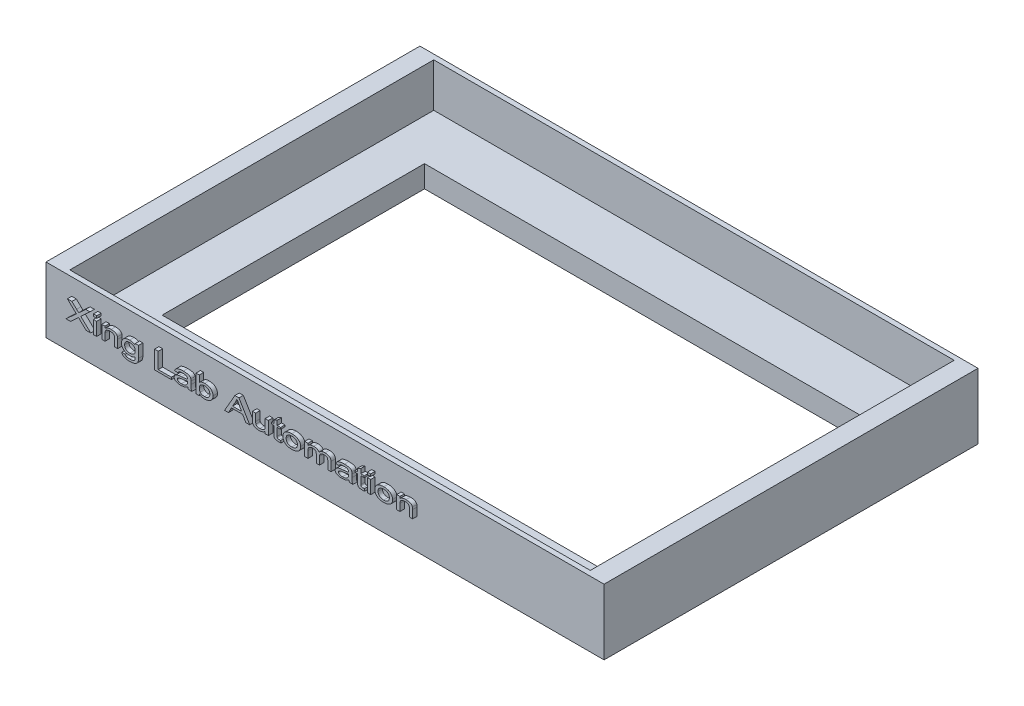
from build123d import *

# Parameters (mm, degrees)
SKETCH_1_W      = 119
SKETCH_1_H      = 83.205034796
EXTRUDE_2_DEPTH = 5
SKETCH_1_4_W    = 127.6
SKETCH_1_4_H    = 85.5
SKETCH_1_4_W_2  = 119
SKETCH_1_4_H_2  = 83.205034796
EXTRUDE_3_DEPTH = 15
SKETCH_2_W      = 0.737568443
SKETCH_2_H      = 0.526834602
SKETCH_2_H_2    = 3.002957231
EXTRUDE_4_DEPTH = 1


with BuildPart() as part:
    # 草图1 → 凸台-拉伸2 (new body)
    with BuildSketch(Plane(origin=(0, 0, 0), x_dir=(1, 0, 0), z_dir=(0, 1, 0))):
        with Locations((0, 0.002380306)):
            Rectangle(SKETCH_1_W, SKETCH_1_H)
        Polygon((-1.5, -30), (-50, -30), (-50, -1.5), (-50, 1.5), (-50, 30), (-1.5, 30), (1.5, 30), (50, 30), (50, 1.5), (50, -1.5), (50, -30), (1.5, -30), align=None, mode=Mode.SUBTRACT)
    extrude(amount=EXTRUDE_2_DEPTH)

    # 草图1<4> → 凸台-拉伸3 (add)
    with BuildSketch(Plane(origin=(0, 0, 0), x_dir=(1, 0, 0), z_dir=(0, 1, 0))):
        Rectangle(SKETCH_1_4_W, SKETCH_1_4_H)
        with Locations((0, 0.002380306)):
            Rectangle(SKETCH_1_4_W_2, SKETCH_1_4_H_2, mode=Mode.SUBTRACT)
    extrude(amount=EXTRUDE_3_DEPTH)

    # 草图2 → 凸台-拉伸4 (add)
    # profile 1 of 19: a face of its own
    with BuildSketch(Plane.XY.offset(42.75)):
        with BuildLine():
            Line((-58.222779565, 7.045312338), (-55.862725184, 9.196279236))
            Line((-55.862725184, 9.196279236), (-57.906678804, 11.154622233))
            Line((-57.906678804, 11.154622233), (-56.874412255, 11.154622233))
            Line((-56.874412255, 11.154622233), (-55.80427947, 10.129764297))
            add(Edge.make_bspline(
                [(-55.80427947, 10.129764297), (-55.776867338, 10.103394212), (-55.724000236, 10.052536806), (-55.647903293, 9.98020285), (-55.579463067, 9.913335505), (-55.516395577, 9.854894695), (-55.462075578, 9.800489435), (-55.411904616, 9.755522688), (-55.371374441, 9.714216062), (-55.345311007, 9.690365715), (-55.333421044, 9.679485348)],
                knots=[0, 0, 0, 0, 1.40115503, 2.702270826, 3.867471819, 4.92565285, 5.869199709, 6.698774859, 7.406389885, 8, 8, 8, 8], degree=3))
            add(Edge.make_bspline(
                [(-55.333421044, 9.679485348), (-55.305141704, 9.704985261), (-55.24353872, 9.760533615), (-55.14395698, 9.851109769), (-55.029786474, 9.955654593), (-54.948469984, 10.02963533), (-54.90536793, 10.068849046)],
                knots=[0, 0, 0, 0, 0.789667951, 1.720192303, 2.791580952, 4, 4, 4, 4], degree=3))
            Line((-54.90536793, 10.068849046), (-53.715051001, 11.154622233))
            Line((-53.715051001, 11.154622233), (-52.743699704, 11.154622233))
            Line((-52.743699704, 11.154622233), (-54.842806321, 9.207803743))
            Line((-54.842806321, 9.207803743), (-52.585649323, 7.045312338))
            Line((-52.585649323, 7.045312338), (-53.617915872, 7.045312338))
            Line((-53.617915872, 7.045312338), (-55.137504427, 8.501516105))
            add(Edge.make_bspline(
                [(-55.137504427, 8.501516105), (-55.17839724, 8.540745715), (-55.254720594, 8.613964826), (-55.330957702, 8.687273731), (-55.366348207, 8.721304915)],
                knots=[0, 0, 0, 0, 1.071567501, 2, 2, 2, 2], degree=3))
            add(Edge.make_bspline(
                [(-55.366348207, 8.721304915), (-55.400444233, 8.690101068), (-55.463041607, 8.632813487), (-55.54785454, 8.553223858), (-55.617042019, 8.489353876), (-55.657500542, 8.45132507), (-55.675040357, 8.434838601)],
                knots=[0, 0, 0, 0, 1.316971092, 2.417845725, 3.314095273, 4, 4, 4, 4], degree=3))
            Line((-55.675040357, 8.434838601), (-57.174049435, 7.045312338))
            Line((-57.174049435, 7.045312338), (-58.222779565, 7.045312338))
        make_face()
    # profile 2 of 19: a face of its own
    with BuildSketch(Plane.XY.offset(42.75)):
        with Locations((-51.569846357, 10.891204932)):
            Rectangle(SKETCH_2_W, SKETCH_2_H)
    # profile 3 of 19: a face of its own
    with BuildSketch(Plane.XY.offset(42.75)):
        with Locations((-51.569846357, 8.546790954)):
            Rectangle(SKETCH_2_W, SKETCH_2_H_2)
    # profile 4 of 19: a face of its own
    with BuildSketch(Plane.XY.offset(42.75)):
        with BuildLine():
            Line((-50.04202601, 7.045312338), (-50.04202601, 10.048269569))
            Line((-50.04202601, 10.048269569), (-49.304457567, 10.048269569))
            Line((-49.304457567, 10.048269569), (-49.304457567, 9.629271425))
            add(Edge.make_bspline(
                [(-49.304457567, 9.629271425), (-49.262781892, 9.66709552), (-49.178794098, 9.743321335), (-49.036115213, 9.839087135), (-48.880532784, 9.920256768), (-48.711877168, 9.987373705), (-48.529181407, 10.037443316), (-48.333798921, 10.074623075), (-48.125086331, 10.096971462), (-47.981389961, 10.099601207), (-47.907522693, 10.100953029)],
                knots=[0, 0, 0, 0, 0.892340397, 1.798307998, 2.717783362, 3.673708849, 4.673358127, 5.719693935, 6.827806306, 8, 8, 8, 8], degree=3))
            add(Edge.make_bspline(
                [(-47.907522693, 10.100953029), (-47.842723406, 10.099939814), (-47.715331487, 10.097947888), (-47.52852038, 10.07952472), (-47.349659241, 10.049196737), (-47.180955106, 10.00695563), (-47.026583712, 9.955131337), (-46.889750979, 9.897018592), (-46.775190683, 9.828343111), (-46.67985811, 9.752396211), (-46.602245405, 9.668282712), (-46.537504748, 9.577913154), (-46.484546056, 9.480110212), (-46.460259666, 9.410149475), (-46.44802621, 9.374909094)],
                knots=[0, 0, 0, 0, 1.334802986, 2.624151016, 3.863084231, 5.069710293, 6.203168805, 7.215753571, 8.126171055, 8.946409761, 9.71845364, 10.476206912, 11.2324402, 12, 12, 12, 12], degree=3))
            add(Edge.make_bspline(
                [(-46.44802621, 9.374909094), (-46.44456144, 9.362053485), (-46.437174024, 9.334643376), (-46.429037876, 9.289503302), (-46.423211805, 9.237730759), (-46.415748489, 9.17942795), (-46.412583049, 9.114520588), (-46.408784701, 9.043208519), (-46.407566679, 8.965242831), (-46.40710658, 8.9109098), (-46.406867256, 8.882648012)],
                knots=[0, 0, 0, 0, 0.644987449, 1.375211225, 2.219623254, 3.169655122, 4.222187575, 5.366930599, 6.630386613, 8, 8, 8, 8], degree=3))
            Line((-46.406867256, 8.882648012), (-46.406867256, 7.045312338))
            Line((-46.406867256, 7.045312338), (-47.144435699, 7.045312338))
            Line((-47.144435699, 7.045312338), (-47.144435699, 8.838196343))
            add(Edge.make_bspline(
                [(-47.144435699, 8.838196343), (-47.145494326, 8.885981394), (-47.147472893, 8.975291421), (-47.162943648, 9.100151411), (-47.19141169, 9.205807345), (-47.231073866, 9.295447315), (-47.287725988, 9.37024777), (-47.360225935, 9.435169154), (-47.450309371, 9.491755883), (-47.556641097, 9.539470025), (-47.675924438, 9.578230635), (-47.806179307, 9.607468355), (-47.946635555, 9.623433324), (-48.043583286, 9.625656045), (-48.093561162, 9.626801888)],
                knots=[0, 0, 0, 0, 1.204910874, 2.25197254, 3.163467592, 3.956008041, 4.707432073, 5.510772209, 6.397534482, 7.379034001, 8.442428638, 9.555405936, 10.739778475, 12, 12, 12, 12], degree=3))
            add(Edge.make_bspline(
                [(-48.093561162, 9.626801888), (-48.133906408, 9.626070366), (-48.21360045, 9.624625389), (-48.331115943, 9.61616461), (-48.444091447, 9.598750334), (-48.553346987, 9.578389954), (-48.657819123, 9.548844291), (-48.758533138, 9.514880544), (-48.854579305, 9.472985964), (-48.946342902, 9.426334566), (-49.031977288, 9.371132108), (-49.104688521, 9.301375722), (-49.167249842, 9.221784417), (-49.217915183, 9.130269509), (-49.25734719, 9.027490422), (-49.28484728, 8.913210415), (-49.301288897, 8.787911485), (-49.303373266, 8.700777986), (-49.304457567, 8.65545059)],
                knots=[0, 0, 0, 0, 1.089534928, 2.152160457, 3.177960772, 4.174747821, 5.150777213, 6.106746925, 7.042637586, 7.977119478, 8.885386807, 9.781638081, 10.684236735, 11.609687324, 12.594841562, 13.64786681, 14.776405496, 16, 16, 16, 16], degree=3))
            Line((-49.304457567, 8.65545059), (-49.304457567, 7.045312338))
            Line((-49.304457567, 7.045312338), (-50.04202601, 7.045312338))
        make_face()
    # profile 5 of 19: a face of its own
    with BuildSketch(Plane.XY.offset(42.75)):
        with BuildLine():
            Line((-45.45197954, 6.834578497), (-44.714411097, 6.781895037))
            add(Edge.make_bspline(
                [(-44.714411097, 6.781895037), (-44.710237173, 6.765267192), (-44.702046848, 6.732639031), (-44.681486266, 6.687049238), (-44.656886672, 6.644414494), (-44.626003644, 6.60573564), (-44.590407552, 6.570071035), (-44.549681026, 6.538000546), (-44.504265684, 6.508535525), (-44.470704906, 6.493351329), (-44.453463333, 6.485550573)],
                knots=[0, 0, 0, 0, 1.000066515, 1.962390866, 2.911259237, 3.870505427, 4.845704698, 5.850005269, 6.895457948, 8, 8, 8, 8], degree=3))
            add(Edge.make_bspline(
                [(-44.453463333, 6.485550573), (-44.428666572, 6.475183206), (-44.377658279, 6.453856967), (-44.29528789, 6.430454748), (-44.207525949, 6.407256646), (-44.112399038, 6.390992268), (-44.011482804, 6.376284631), (-43.903654827, 6.368370571), (-43.789537809, 6.360739936), (-43.710971427, 6.360533421), (-43.670620042, 6.360427355)],
                knots=[0, 0, 0, 0, 0.807576017, 1.661227995, 2.57188882, 3.536582376, 4.561249234, 5.637866165, 6.786817335, 8, 8, 8, 8], degree=3))
            add(Edge.make_bspline(
                [(-43.670620042, 6.360427355), (-43.627250814, 6.36052331), (-43.543201199, 6.36070927), (-43.421129533, 6.36840542), (-43.30644438, 6.376196655), (-43.199493114, 6.390973036), (-43.099693257, 6.40710546), (-43.008328415, 6.430321425), (-42.923606906, 6.453947402), (-42.846922633, 6.484180939), (-42.776456207, 6.517064198), (-42.712383625, 6.55319328), (-42.653760134, 6.592205491), (-42.601449866, 6.634710128), (-42.554743504, 6.680361593), (-42.514388855, 6.728846044), (-42.479800738, 6.780728696), (-42.461528146, 6.817622723), (-42.452315025, 6.836224855)],
                knots=[0, 0, 0, 0, 1.509157588, 2.924749178, 4.256469979, 5.508653603, 6.68158384, 7.772642171, 8.788092742, 9.74054915, 10.637771474, 11.493093977, 12.298374084, 13.085958602, 13.835625472, 14.568121415, 15.278040506, 16, 16, 16, 16], degree=3))
            add(Edge.make_bspline(
                [(-42.452315025, 6.836224855), (-42.447409484, 6.849317802), (-42.436639345, 6.878063434), (-42.424722969, 6.926912564), (-42.415238774, 6.985014229), (-42.406876477, 7.052548146), (-42.401703685, 7.129771516), (-42.397320948, 7.216209794), (-42.39605243, 7.31201975), (-42.3962403, 7.378974984), (-42.396338848, 7.414096559)],
                knots=[0, 0, 0, 0, 0.574715752, 1.26179139, 2.063357563, 2.995691196, 4.059541589, 5.245946624, 6.555352761, 8, 8, 8, 8], degree=3))
            add(Edge.make_bspline(
                [(-42.396338848, 7.414096559), (-42.438352049, 7.384478767), (-42.522454496, 7.325189573), (-42.658640557, 7.250417053), (-42.802169811, 7.186936683), (-42.953398203, 7.135045474), (-43.111989659, 7.094708442), (-43.277951759, 7.066166935), (-43.451542172, 7.048431964), (-43.569874364, 7.046366685), (-43.630284268, 7.045312338)],
                knots=[0, 0, 0, 0, 0.940830044, 1.883363045, 2.839568996, 3.812180627, 4.807975686, 5.83327226, 6.893861331, 8, 8, 8, 8], degree=3))
            add(Edge.make_bspline(
                [(-43.630284268, 7.045312338), (-43.704704653, 7.046347422), (-43.84975709, 7.0483649), (-44.060692299, 7.070629594), (-44.259028006, 7.104375085), (-44.444216468, 7.152900821), (-44.616451863, 7.21524676), (-44.775294162, 7.292447891), (-44.922439679, 7.381903847), (-45.054049066, 7.486692927), (-45.171545191, 7.60039186), (-45.275328707, 7.719547026), (-45.362346589, 7.845571084), (-45.433534878, 7.976967193), (-45.489241825, 8.113845641), (-45.529034085, 8.256275247), (-45.552290885, 8.404439979), (-45.555648766, 8.505002832), (-45.55734646, 8.555845923)],
                knots=[0, 0, 0, 0, 1.302582345, 2.538857382, 3.709456856, 4.822366588, 5.886318447, 6.911296292, 7.910005099, 8.895217221, 9.850004907, 10.769784429, 11.657366515, 12.525862541, 13.38146546, 14.239412316, 15.109872908, 16, 16, 16, 16], degree=3))
            add(Edge.make_bspline(
                [(-45.55734646, 8.555845923), (-45.556785445, 8.591269753), (-45.555673817, 8.661460563), (-45.544582663, 8.765740429), (-45.526438617, 8.867726003), (-45.501707501, 8.967564965), (-45.470363147, 9.065313369), (-45.431524268, 9.16104766), (-45.385285189, 9.254676219), (-45.332782871, 9.346342134), (-45.273001577, 9.433817304), (-45.20677014, 9.516718958), (-45.134106994, 9.594340851), (-45.054830732, 9.666611026), (-44.970002317, 9.734609439), (-44.878041612, 9.796322499), (-44.779999151, 9.852945795), (-44.676250926, 9.905012721), (-44.566675736, 9.950834197), (-44.452430662, 9.991284479), (-44.333028145, 10.024991497), (-44.209397351, 10.0529058), (-44.080735884, 10.074210945), (-43.947804622, 10.089887879), (-43.809862361, 10.098908692), (-43.716456493, 10.10026404), (-43.668973684, 10.100953029)],
                knots=[0, 0, 0, 0, 0.930704056, 1.844150468, 2.752315562, 3.651301076, 4.545268904, 5.447833748, 6.36375328, 7.287728051, 8.221806406, 9.145302659, 10.073853049, 11.012983965, 11.962385834, 12.928430141, 13.920396017, 14.936267491, 15.97691996, 17.039748281, 18.119445442, 19.235613089, 20.368979876, 21.5452169, 22.752112678, 24, 24, 24, 24], degree=3))
            add(Edge.make_bspline(
                [(-43.668973684, 10.100953029), (-43.60608376, 10.099741417), (-43.482727005, 10.097364875), (-43.301883806, 10.077136487), (-43.129207697, 10.044486498), (-42.964958978, 9.99846658), (-42.809370841, 9.939230038), (-42.662830428, 9.865875191), (-42.523570569, 9.78105684), (-42.438751051, 9.713343813), (-42.396338848, 9.679485348)],
                knots=[0, 0, 0, 0, 1.102195066, 2.161923522, 3.185490193, 4.179887977, 5.14824547, 6.099061533, 7.049475994, 8, 8, 8, 8], degree=3))
            Line((-42.396338848, 9.679485348), (-42.396338848, 10.048269569))
            Line((-42.396338848, 10.048269569), (-41.658770405, 10.048269569))
            Line((-41.658770405, 10.048269569), (-41.658770405, 7.489005854))
            add(Edge.make_bspline(
                [(-41.658770405, 7.489005854), (-41.65934311, 7.433560747), (-41.660446978, 7.326692252), (-41.670492676, 7.172589551), (-41.686162318, 7.030611302), (-41.710317998, 6.901526251), (-41.73903093, 6.784382754), (-41.776521378, 6.680538079), (-41.818302011, 6.587952791), (-41.870105465, 6.508358785), (-41.928425185, 6.436966561), (-41.993532556, 6.370413348), (-42.066338459, 6.307397066), (-42.147548175, 6.249303114), (-42.235590601, 6.19392486), (-42.331805774, 6.142976915), (-42.435541685, 6.095054332), (-42.547371621, 6.052034721), (-42.665772758, 6.012083856), (-42.791546806, 5.978688094), (-42.92362119, 5.949840114), (-43.062697712, 5.927002306), (-43.207979734, 5.909036475), (-43.360095627, 5.896003138), (-43.518781106, 5.887402476), (-43.626979914, 5.88665653), (-43.682144549, 5.886276213)],
                knots=[0, 0, 0, 0, 1.331751205, 2.566903662, 3.708286618, 4.760664026, 5.719885332, 6.601797317, 7.409764718, 8.153937112, 8.875582325, 9.621387701, 10.387822022, 11.185506766, 12.017660392, 12.884641531, 13.7989424, 14.761058246, 15.761582995, 16.799305081, 17.885329325, 19.007982197, 20.183661604, 21.401080925, 22.674953792, 24, 24, 24, 24], degree=3))
            add(Edge.make_bspline(
                [(-43.682144549, 5.886276213), (-43.747198152, 5.88671099), (-43.874396055, 5.887561099), (-44.060258393, 5.899936178), (-44.23677898, 5.917010292), (-44.403408573, 5.943920246), (-44.560741165, 5.976328516), (-44.708674074, 6.016223693), (-44.846376393, 6.065399895), (-44.974439688, 6.119414973), (-45.090293693, 6.181248355), (-45.190329271, 6.252136353), (-45.275363429, 6.330084264), (-45.343233707, 6.416491744), (-45.396690599, 6.509909398), (-45.431686482, 6.611833137), (-45.452470005, 6.720941279), (-45.452145749, 6.796069155), (-45.45197954, 6.834578497)],
                knots=[0, 0, 0, 0, 1.394318853, 2.726281471, 3.991741937, 5.194796866, 6.342702213, 7.434384059, 8.476243584, 9.474947068, 10.411998632, 11.285227617, 12.096844667, 12.875897124, 13.631798085, 14.392717757, 15.176132951, 16, 16, 16, 16], degree=3))
        make_face()
        with BuildLine():
            add(Edge.make_bspline(
                [(-44.819778018, 8.592065802), (-44.818580062, 8.547024922), (-44.816256941, 8.459679952), (-44.801012868, 8.333264085), (-44.773891629, 8.216520041), (-44.735966783, 8.109252579), (-44.687165858, 8.011287605), (-44.627731785, 7.922442589), (-44.556873758, 7.843424689), (-44.475804255, 7.774446184), (-44.386627842, 7.714671332), (-44.291571606, 7.662945853), (-44.19159864, 7.618005706), (-44.085748073, 7.581872103), (-43.974485533, 7.553918854), (-43.857736716, 7.534541587), (-43.735938177, 7.521668641), (-43.652818366, 7.520207096), (-43.61052797, 7.519463479)],
                knots=[0, 0, 0, 0, 1.176720128, 2.281939986, 3.320025913, 4.301809522, 5.247548094, 6.172074633, 7.085894869, 8.011171485, 8.945649562, 9.885638082, 10.835497302, 11.805776729, 12.803757513, 13.829067201, 14.895454547, 16, 16, 16, 16], degree=3))
            add(Edge.make_bspline(
                [(-43.61052797, 7.519463479), (-43.568249945, 7.520317013), (-43.485454364, 7.521988537), (-43.363731405, 7.533248861), (-43.247722309, 7.554079736), (-43.136841458, 7.582089352), (-43.030947704, 7.617348364), (-42.930134794, 7.661151722), (-42.834457012, 7.713045739), (-42.744643064, 7.772760757), (-42.662666731, 7.841190084), (-42.589882925, 7.918514908), (-42.531100195, 8.007290397), (-42.480642915, 8.103146304), (-42.443508446, 8.209015679), (-42.414841556, 8.322939528), (-42.399933741, 8.4465211), (-42.397562477, 8.531665599), (-42.396338848, 8.575602221)],
                knots=[0, 0, 0, 0, 1.111496976, 2.176710881, 3.209708351, 4.206976273, 5.181041069, 6.140573195, 7.092810464, 8.039154864, 8.971092712, 9.89503937, 10.819408339, 11.761509144, 12.735894426, 13.761155494, 14.844702057, 16, 16, 16, 16], degree=3))
            add(Edge.make_bspline(
                [(-42.396338848, 8.575602221), (-42.39743961, 8.617913081), (-42.399571393, 8.699854076), (-42.416188934, 8.818843999), (-42.444130738, 8.929876773), (-42.483284239, 9.033331158), (-42.53527827, 9.128035804), (-42.597103463, 9.21538257), (-42.671116691, 9.293883281), (-42.755336361, 9.363692419), (-42.847705974, 9.424603022), (-42.944449874, 9.479409913), (-43.046745243, 9.524495561), (-43.152710748, 9.562773811), (-43.263842323, 9.591429555), (-43.379421895, 9.611902689), (-43.499667599, 9.624513441), (-43.581411629, 9.626031741), (-43.622875656, 9.626801888)],
                knots=[0, 0, 0, 0, 1.114720679, 2.15881507, 3.158470241, 4.126692766, 5.065049969, 5.998098572, 6.939404404, 7.899492284, 8.874173644, 9.851827785, 10.826106723, 11.816434219, 12.81789229, 13.846243382, 14.907523623, 16, 16, 16, 16], degree=3))
            add(Edge.make_bspline(
                [(-43.622875656, 9.626801888), (-43.663790405, 9.626034622), (-43.744165554, 9.624527363), (-43.862244333, 9.611973701), (-43.975215445, 9.591204078), (-44.084014681, 9.563698994), (-44.187646265, 9.525884225), (-44.287833314, 9.482336419), (-44.381722379, 9.427602004), (-44.471522717, 9.36781308), (-44.553357877, 9.298827874), (-44.624531015, 9.220928759), (-44.685028337, 9.135472429), (-44.735335257, 9.042326431), (-44.77267867, 8.940404174), (-44.799769079, 8.831110348), (-44.816556653, 8.714136429), (-44.818683101, 8.633556647), (-44.819778018, 8.592065802)],
                knots=[0, 0, 0, 0, 1.100126261, 2.161147634, 3.188798452, 4.18750765, 5.1748108, 6.152581528, 7.120950933, 8.093136588, 9.05121713, 9.991368739, 10.922967255, 11.860566936, 12.829610889, 13.833649184, 14.884537489, 16, 16, 16, 16], degree=3))
        make_face(mode=Mode.SUBTRACT)
    # profile 6 of 19: a face of its own
    with BuildSketch(Plane.XY.offset(42.75)):
        Polygon((-37.977513624, 7.045312338), (-37.977513624, 11.154622233), (-37.134578261, 11.154622233), (-37.134578261, 7.519463479), (-34.131621029, 7.519463479), (-34.131621029, 7.045312338), align=None)
    # profile 7 of 19: a face of its own
    with BuildSketch(Plane.XY.offset(42.75)):
        with BuildLine():
            add(Edge.make_bspline(
                [(-30.391095355, 7.414096559), (-30.459280017, 7.377602847), (-30.592450612, 7.306327442), (-30.794494964, 7.215693164), (-30.992127584, 7.141943478), (-31.18723304, 7.085056748), (-31.383576368, 7.043776556), (-31.584544515, 7.014443369), (-31.79260876, 6.995574826), (-31.933691665, 6.993621166), (-32.005349502, 6.992628877)],
                knots=[0, 0, 0, 0, 1.099122326, 2.146681806, 3.145131152, 4.095639367, 5.032808011, 5.994867275, 6.981567089, 8, 8, 8, 8], degree=3))
            add(Edge.make_bspline(
                [(-32.005349502, 6.992628877), (-32.063534327, 6.99353618), (-32.176711038, 6.995300997), (-32.341360238, 7.00555517), (-32.495812842, 7.024475309), (-32.63978484, 7.050820367), (-32.773817231, 7.083031856), (-32.896840487, 7.124298146), (-33.009561719, 7.172896882), (-33.111582636, 7.228553189), (-33.20219009, 7.290506074), (-33.281912448, 7.355812509), (-33.348502024, 7.426640386), (-33.40341858, 7.501162515), (-33.447165181, 7.580047866), (-33.477405124, 7.663699148), (-33.496450476, 7.751290689), (-33.498420944, 7.811045095), (-33.499419507, 7.841326494)],
                knots=[0, 0, 0, 0, 1.467352503, 2.854182901, 4.157889263, 5.388888655, 6.543520828, 7.631035463, 8.656833932, 9.635406056, 10.55664219, 11.421336781, 12.229029369, 13.001295773, 13.750686536, 14.494980542, 15.237309901, 16, 16, 16, 16], degree=3))
            add(Edge.make_bspline(
                [(-33.499419507, 7.841326494), (-33.497818623, 7.87720368), (-33.494640021, 7.948438934), (-33.46467463, 8.05181294), (-33.419260338, 8.150778735), (-33.353846048, 8.242371283), (-33.275114106, 8.327668194), (-33.183558304, 8.404203057), (-33.082035665, 8.473380383), (-32.968193619, 8.531026489), (-32.845707746, 8.581599663), (-32.715339677, 8.62595942), (-32.577661908, 8.664116633), (-32.48265067, 8.68345867), (-32.434225796, 8.693316827)],
                knots=[0, 0, 0, 0, 0.871887231, 1.731158875, 2.60120008, 3.513317807, 4.45918451, 5.421829971, 6.413476087, 7.44468695, 8.52321132, 9.63908277, 10.796698974, 12, 12, 12, 12], degree=3))
            add(Edge.make_bspline(
                [(-32.434225796, 8.693316827), (-32.414752349, 8.696657203), (-32.373669194, 8.703704398), (-32.308423389, 8.713857766), (-32.236082742, 8.722153432), (-32.157209129, 8.732770765), (-32.071174063, 8.741064923), (-31.978280902, 8.751632913), (-31.87804704, 8.760196616), (-31.808884026, 8.76603707), (-31.773213006, 8.769049301)],
                knots=[0, 0, 0, 0, 0.7124815, 1.503123103, 2.380626033, 3.337901957, 4.372682653, 5.497061812, 6.709102535, 8, 8, 8, 8], degree=3))
            add(Edge.make_bspline(
                [(-31.773213006, 8.769049301), (-31.700769525, 8.775313269), (-31.560511144, 8.787440984), (-31.357611053, 8.805756372), (-31.169670047, 8.826484811), (-30.996856347, 8.848110809), (-30.838344041, 8.868902511), (-30.694852658, 8.892034342), (-30.566016237, 8.915447308), (-30.485711037, 8.933442726), (-30.44789471, 8.941916905)],
                knots=[0, 0, 0, 0, 1.30468558, 2.52601179, 3.655261562, 4.697057442, 5.650966829, 6.52351024, 7.304709779, 8, 8, 8, 8], degree=3))
            add(Edge.make_bspline(
                [(-30.44789471, 8.941916905), (-30.44739133, 8.956461913), (-30.446479398, 8.982811943), (-30.444667574, 9.017913316), (-30.443660812, 9.044259772), (-30.443745335, 9.058807923), (-30.443778815, 9.064570586)],
                knots=[0, 0, 0, 0, 1.422878145, 2.577714779, 3.436619076, 4, 4, 4, 4], degree=3))
            add(Edge.make_bspline(
                [(-30.443778815, 9.064570586), (-30.444353888, 9.087658898), (-30.445461872, 9.132142723), (-30.455541992, 9.19624132), (-30.471885157, 9.255209895), (-30.494915376, 9.309050029), (-30.524652736, 9.357813059), (-30.562545854, 9.399671344), (-30.605564318, 9.437666594), (-30.638526609, 9.457708099), (-30.655335835, 9.467928328)],
                knots=[0, 0, 0, 0, 1.1536287, 2.222675128, 3.234567423, 4.205458348, 5.141915443, 6.074950024, 7.018314641, 8, 8, 8, 8], degree=3))
            add(Edge.make_bspline(
                [(-30.655335835, 9.467928328), (-30.68034767, 9.48079545), (-30.732256818, 9.507499661), (-30.817900899, 9.538681264), (-30.911194763, 9.566872757), (-31.013654121, 9.588874786), (-31.12444516, 9.605874164), (-31.244235259, 9.618049542), (-31.372504174, 9.625487613), (-31.46094326, 9.626355033), (-31.506502989, 9.626801888)],
                knots=[0, 0, 0, 0, 0.771401897, 1.600954748, 2.496984787, 3.445485948, 4.474542614, 5.572519321, 6.749474194, 8, 8, 8, 8], degree=3))
            add(Edge.make_bspline(
                [(-31.506502989, 9.626801888), (-31.549038904, 9.626509939), (-31.631123053, 9.625946547), (-31.74999847, 9.620971796), (-31.860373827, 9.612864886), (-31.962311798, 9.601668311), (-32.055336619, 9.58664368), (-32.139981013, 9.57000814), (-32.215822199, 9.548463763), (-32.284281922, 9.523884816), (-32.346216926, 9.494529654), (-32.403262539, 9.460989094), (-32.455525717, 9.421572096), (-32.504292961, 9.378052504), (-32.548865054, 9.329164149), (-32.589553951, 9.275269787), (-32.625612624, 9.21608369), (-32.646116228, 9.173954115), (-32.656484143, 9.152650746)],
                knots=[0, 0, 0, 0, 1.538696914, 2.969317239, 4.303133498, 5.541808666, 6.677616391, 7.711329472, 8.660312252, 9.52702798, 10.339587239, 11.136288664, 11.916494485, 12.703740655, 13.497654562, 14.305653797, 15.143231738, 16, 16, 16, 16], degree=3))
            Line((-32.656484143, 9.152650746), (-33.394052586, 9.205334206))
            add(Edge.make_bspline(
                [(-33.394052586, 9.205334206), (-33.37595365, 9.255050702), (-33.340472816, 9.352514043), (-33.264494721, 9.486287538), (-33.17179546, 9.604315068), (-33.08222377, 9.691414203), (-33.00082299, 9.752591573), (-32.933353661, 9.796440165), (-32.858514633, 9.836278122), (-32.778554647, 9.875433755), (-32.691084448, 9.909335049), (-32.598355267, 9.942799917), (-32.498398536, 9.971962468), (-32.354629639, 10.008791876), (-32.162193077, 10.046752533), (-31.916915691, 10.078389562), (-31.654422239, 10.097212915), (-31.473607429, 10.099682258), (-31.380556591, 10.100953029)],
                knots=[0, 0, 0, 0, 1.072817813, 2.103133121, 3.107253628, 4.11199215, 4.628999136, 5.172949408, 5.743848997, 6.349363435, 6.97939556, 7.647212873, 8.350524322, 9.092344716, 10.660213573, 12.329047941, 14.110856293, 16, 16, 16, 16], degree=3))
            add(Edge.make_bspline(
                [(-31.380556591, 10.100953029), (-31.334180934, 10.100592094), (-31.24333245, 10.099885032), (-31.110499, 10.095687364), (-30.984213321, 10.089372283), (-30.864759628, 10.079714085), (-30.752067953, 10.066024474), (-30.645919846, 10.051935665), (-30.546494532, 10.033720467), (-30.453829152, 10.012183289), (-30.367082462, 9.989102825), (-30.286485224, 9.964781091), (-30.212096167, 9.93786515), (-30.14301824, 9.911429799), (-30.080188673, 9.882327679), (-30.023222797, 9.85234104), (-29.972863464, 9.819624669), (-29.912653667, 9.776729037), (-29.848143337, 9.714943891), (-29.781515892, 9.63371037), (-29.728460781, 9.542056261), (-29.703897437, 9.476024234), (-29.691393149, 9.442409777)],
                knots=[0, 0, 0, 0, 1.439796539, 2.820517066, 4.125690756, 5.365155513, 6.540178449, 7.649764385, 8.689071359, 9.67686088, 10.602604169, 11.475698901, 12.289422009, 13.058250654, 13.771044678, 14.438026885, 15.054810062, 15.634158552, 16.731081884, 17.815395527, 18.887898845, 20, 20, 20, 20], degree=3))
            add(Edge.make_bspline(
                [(-29.691393149, 9.442409777), (-29.68817706, 9.430654957), (-29.68120844, 9.405184619), (-29.674435643, 9.362940506), (-29.667826019, 9.314368504), (-29.662005922, 9.259209994), (-29.657979502, 9.197152017), (-29.655849686, 9.128515293), (-29.654110963, 9.053328615), (-29.653726973, 9.001186958), (-29.653526912, 8.974020889)],
                knots=[0, 0, 0, 0, 0.620412976, 1.344310591, 2.176564568, 3.118193958, 4.168877629, 5.343785579, 6.616098728, 8, 8, 8, 8], degree=3))
            Line((-29.653526912, 8.974020889), (-29.653526912, 8.294898159))
            add(Edge.make_bspline(
                [(-29.653526912, 8.294898159), (-29.653306122, 8.238372844), (-29.652885969, 8.130807758), (-29.651458858, 7.977685924), (-29.648414621, 7.841285219), (-29.643148799, 7.721117467), (-29.638071792, 7.617312221), (-29.630407902, 7.52979475), (-29.622945189, 7.458801786), (-29.609907891, 7.386032524), (-29.586776008, 7.306889832), (-29.549013151, 7.217179606), (-29.501597682, 7.128982777), (-29.462586963, 7.073476177), (-29.442793071, 7.045312338)],
                knots=[0, 0, 0, 0, 1.574527015, 2.996252761, 4.265399722, 5.374618653, 6.346784129, 7.159883148, 7.821631042, 8.334355502, 9.217307448, 10.111567109, 11.041816277, 12, 12, 12, 12], degree=3))
            Line((-29.442793071, 7.045312338), (-30.180361514, 7.045312338))
            add(Edge.make_bspline(
                [(-30.180361514, 7.045312338), (-30.206305348, 7.071962003), (-30.257155433, 7.124195522), (-30.316039248, 7.215341643), (-30.364242555, 7.310878758), (-30.382130738, 7.37963803), (-30.391095355, 7.414096559)],
                knots=[0, 0, 0, 0, 1.033656025, 2.025972594, 3.010721338, 4, 4, 4, 4], degree=3))
        make_face()
        with BuildLine():
            add(Edge.make_bspline(
                [(-30.443778815, 8.573132684), (-30.480470579, 8.563215646), (-30.557852348, 8.542300927), (-30.681642375, 8.515880536), (-30.818047748, 8.489572387), (-30.967372717, 8.464192502), (-31.129503056, 8.43931934), (-31.304965731, 8.416754753), (-31.493150496, 8.394217691), (-31.623094209, 8.381369139), (-31.69007192, 8.374746529)],
                knots=[0, 0, 0, 0, 0.721922124, 1.522510893, 2.403733928, 3.360953104, 4.399674802, 5.519511503, 6.721466088, 8, 8, 8, 8], degree=3))
            add(Edge.make_bspline(
                [(-31.69007192, 8.374746529), (-31.727955204, 8.371060829), (-31.800765151, 8.363977083), (-31.905248384, 8.351301281), (-32.001107356, 8.33931802), (-32.088313058, 8.32595715), (-32.167353219, 8.31282977), (-32.238019839, 8.300032631), (-32.29988164, 8.286256259), (-32.369176249, 8.266694982), (-32.445370825, 8.239789714), (-32.527386715, 8.201293662), (-32.597940811, 8.155157377), (-32.656822338, 8.102408537), (-32.703573841, 8.044653975), (-32.737002405, 7.983020629), (-32.758263896, 7.917883125), (-32.760646885, 7.873041145), (-32.761851064, 7.850381464)],
                knots=[0, 0, 0, 0, 1.403982305, 2.698390033, 3.882298214, 4.967366097, 5.952465249, 6.837879649, 7.616274152, 8.289204687, 9.492979422, 10.593097249, 11.623388323, 12.590910465, 13.498269283, 14.349707251, 15.166069194, 16, 16, 16, 16], degree=3))
            add(Edge.make_bspline(
                [(-32.761851064, 7.850381464), (-32.761397166, 7.833283272), (-32.76049315, 7.799229228), (-32.747725087, 7.749980467), (-32.731190778, 7.701911694), (-32.704451221, 7.657504212), (-32.672549313, 7.613855775), (-32.631616429, 7.574287338), (-32.584871587, 7.535534588), (-32.530701101, 7.499896807), (-32.469894753, 7.466593201), (-32.401367528, 7.439115228), (-32.327151094, 7.413970064), (-32.245300147, 7.395858663), (-32.157806361, 7.379808871), (-32.063163821, 7.369592564), (-31.962093115, 7.362882894), (-31.892311569, 7.361912915), (-31.856354091, 7.361413099)],
                knots=[0, 0, 0, 0, 0.720378718, 1.434760423, 2.139097264, 2.861060566, 3.614729439, 4.418215413, 5.258506159, 6.178238756, 7.153590206, 8.182862614, 9.293857899, 10.461033616, 11.721096359, 13.051482321, 14.480669103, 16, 16, 16, 16], degree=3))
            add(Edge.make_bspline(
                [(-31.856354091, 7.361413099), (-31.784936087, 7.362902236), (-31.645767796, 7.365804035), (-31.443258832, 7.390982772), (-31.252935914, 7.43164928), (-31.103685002, 7.480203001), (-30.99197839, 7.526277729), (-30.914649569, 7.564313198), (-30.842576732, 7.60446134), (-30.776523088, 7.648194137), (-30.716097883, 7.695114334), (-30.661902427, 7.745520843), (-30.612493184, 7.798132153), (-30.584451908, 7.8363642), (-30.570548391, 7.855320538)],
                knots=[0, 0, 0, 0, 1.801166242, 3.509832461, 5.139182318, 6.704404972, 7.461614056, 8.186060329, 8.877265603, 9.541567819, 10.182707247, 10.804842062, 11.407412898, 12, 12, 12, 12], degree=3))
            add(Edge.make_bspline(
                [(-30.570548391, 7.855320538), (-30.560544578, 7.87073835), (-30.539969455, 7.902448596), (-30.516058835, 7.955729057), (-30.494186482, 8.013550018), (-30.477351673, 8.076768439), (-30.464177302, 8.145284826), (-30.454397563, 8.218929356), (-30.448597024, 8.298096661), (-30.448133309, 8.352510721), (-30.44789471, 8.380508782)],
                knots=[0, 0, 0, 0, 0.80506362, 1.655796908, 2.554556615, 3.515177287, 4.520741764, 5.613568228, 6.77209193, 8, 8, 8, 8], degree=3))
            Line((-30.44789471, 8.380508782), (-30.443778815, 8.573132684))
        make_face(mode=Mode.SUBTRACT)
    # profile 8 of 19: a face of its own
    with BuildSketch(Plane.XY.offset(42.75)):
        with BuildLine():
            Line((-27.756922344, 7.045312338), (-28.494490787, 7.045312338))
            Line((-28.494490787, 7.045312338), (-28.494490787, 11.154622233))
            Line((-28.494490787, 11.154622233), (-27.756922344, 11.154622233))
            Line((-27.756922344, 11.154622233), (-27.756922344, 9.64244229))
            add(Edge.make_bspline(
                [(-27.756922344, 9.64244229), (-27.715686233, 9.679308716), (-27.633844951, 9.752477488), (-27.498428852, 9.845515089), (-27.35482114, 9.924171882), (-27.203335406, 9.989325904), (-27.043152274, 10.039980202), (-26.874586879, 10.074741291), (-26.697797469, 10.096758379), (-26.577098822, 10.099536687), (-26.515568313, 10.100953029)],
                knots=[0, 0, 0, 0, 0.977757563, 1.940554762, 2.898641239, 3.870682322, 4.853248164, 5.865290131, 6.911754298, 8, 8, 8, 8], degree=3))
            add(Edge.make_bspline(
                [(-26.515568313, 10.100953029), (-26.446631926, 10.099887686), (-26.310609461, 10.097785594), (-26.109621112, 10.075056329), (-25.914159163, 10.041145883), (-25.725958964, 9.992752456), (-25.548505376, 9.932715094), (-25.385392486, 9.861576122), (-25.239143984, 9.778224595), (-25.109650088, 9.682484539), (-24.994528287, 9.576777444), (-24.893282435, 9.460298289), (-24.804641613, 9.333838975), (-24.730143473, 9.197356951), (-24.669799076, 9.053817235), (-24.626723394, 8.904139851), (-24.600359404, 8.749409305), (-24.597405823, 8.644304098), (-24.595914732, 8.591242623)],
                knots=[0, 0, 0, 0, 1.208265405, 2.384099963, 3.5421602, 4.684603166, 5.787707206, 6.823860827, 7.80018826, 8.732662222, 9.641806186, 10.535269982, 11.433565791, 12.344388739, 13.256697295, 14.15815726, 15.070161273, 16, 16, 16, 16], degree=3))
            add(Edge.make_bspline(
                [(-24.595914732, 8.591242623), (-24.597659452, 8.529413258), (-24.601072383, 8.408465842), (-24.627543999, 8.232456161), (-24.672176385, 8.067331177), (-24.73400366, 7.912778915), (-24.8143609, 7.769511312), (-24.91282406, 7.637283263), (-25.028492487, 7.515745705), (-25.161522462, 7.407273664), (-25.305660184, 7.309985473), (-25.458332214, 7.225084534), (-25.617955879, 7.152940933), (-25.785043609, 7.094769545), (-25.958801411, 7.048133761), (-26.140130424, 7.01681511), (-26.327955571, 6.996197515), (-26.455694366, 6.993830082), (-26.520507388, 6.992628877)],
                knots=[0, 0, 0, 0, 1.056441619, 2.066556626, 3.033555351, 3.974081829, 4.904226994, 5.832798438, 6.784806514, 7.764155861, 8.760503601, 9.75350152, 10.746322237, 11.750453719, 12.774236792, 13.817438326, 14.892596282, 16, 16, 16, 16], degree=3))
            add(Edge.make_bspline(
                [(-26.520507388, 6.992628877), (-26.584506478, 6.99428402), (-26.70936532, 6.997513116), (-26.891439172, 7.020488975), (-27.062700461, 7.060012985), (-27.223454313, 7.115150154), (-27.373623169, 7.186501563), (-27.513313406, 7.273099991), (-27.642552382, 7.375831098), (-27.718562828, 7.455423897), (-27.756922344, 7.495591287)],
                knots=[0, 0, 0, 0, 1.115319119, 2.175928669, 3.192146744, 4.17369932, 5.132049526, 6.083561856, 7.032848198, 8, 8, 8, 8], degree=3))
            Line((-27.756922344, 7.495591287), (-27.756922344, 7.045312338))
        make_face()
        with BuildLine():
            add(Edge.make_bspline(
                [(-27.756922344, 8.568193609), (-27.756417704, 8.527282095), (-27.755443778, 8.448325331), (-27.744443869, 8.334472862), (-27.72746978, 8.229605794), (-27.703921507, 8.13326313), (-27.672490457, 8.04564197), (-27.635006142, 7.966437817), (-27.590443478, 7.895626554), (-27.554190709, 7.855403026), (-27.536310355, 7.835564241)],
                knots=[0, 0, 0, 0, 1.252470525, 2.417192845, 3.498841117, 4.503566248, 5.449769494, 6.344264849, 7.18336914, 8, 8, 8, 8], degree=3))
            add(Edge.make_bspline(
                [(-27.536310355, 7.835564241), (-27.505689715, 7.805986228), (-27.444681325, 7.747055163), (-27.341535716, 7.672470714), (-27.231392549, 7.608355061), (-27.112862965, 7.556412933), (-26.986454846, 7.516159484), (-26.852202865, 7.487484234), (-26.710033534, 7.469874842), (-26.612481235, 7.467828625), (-26.56248952, 7.466780019)],
                knots=[0, 0, 0, 0, 0.953367827, 1.899484694, 2.844821374, 3.806035168, 4.794267259, 5.813765251, 6.879640698, 8, 8, 8, 8], degree=3))
            add(Edge.make_bspline(
                [(-26.56248952, 7.466780019), (-26.521560851, 7.467450706), (-26.44058306, 7.468777667), (-26.321598692, 7.482918634), (-26.206192037, 7.502467257), (-26.096153849, 7.533712677), (-25.98963434, 7.571429855), (-25.887743723, 7.618355844), (-25.790192764, 7.674005316), (-25.69710304, 7.736765665), (-25.611511864, 7.808521139), (-25.536801531, 7.889849839), (-25.473607659, 7.979465607), (-25.422572491, 8.077673055), (-25.381598721, 8.183507837), (-25.354359844, 8.298464789), (-25.336512619, 8.421107989), (-25.33450961, 8.505839937), (-25.333483175, 8.549260491)],
                knots=[0, 0, 0, 0, 1.063653351, 2.104449013, 3.112070372, 4.10388203, 5.074292161, 6.047975186, 7.016100852, 7.991690168, 8.963672663, 9.912976329, 10.855175457, 11.806193442, 12.784049785, 13.798066567, 14.871627874, 16, 16, 16, 16], degree=3))
            add(Edge.make_bspline(
                [(-25.333483175, 8.549260491), (-25.334594284, 8.593763641), (-25.336755921, 8.680343481), (-25.353288061, 8.805548917), (-25.380328349, 8.921731131), (-25.417935968, 9.029009278), (-25.468019033, 9.126910338), (-25.528004073, 9.216397707), (-25.599692974, 9.296563841), (-25.682531793, 9.365808039), (-25.772071643, 9.426935319), (-25.866114861, 9.481236513), (-25.965567334, 9.525141436), (-26.069023021, 9.562921378), (-26.177413546, 9.591222143), (-26.2901985, 9.611939976), (-26.407444746, 9.624537387), (-26.487274572, 9.62603795), (-26.527915999, 9.626801888)],
                knots=[0, 0, 0, 0, 1.172449849, 2.280973832, 3.320999251, 4.31127443, 5.268448283, 6.211008777, 7.142942796, 8.091915716, 9.048597856, 9.997460584, 10.948936923, 11.90954572, 12.896965854, 13.896803547, 14.929261008, 16, 16, 16, 16], degree=3))
            add(Edge.make_bspline(
                [(-26.527915999, 9.626801888), (-26.568838403, 9.626099188), (-26.649803797, 9.624708889), (-26.768927904, 9.611024548), (-26.883981492, 9.58978886), (-26.994596904, 9.559975869), (-27.101220934, 9.522514395), (-27.202922269, 9.474696578), (-27.30122986, 9.420030471), (-27.393567305, 9.35578932), (-27.479503917, 9.285476208), (-27.553547431, 9.205153665), (-27.616590966, 9.117647625), (-27.667655058, 9.021940992), (-27.708694073, 8.919443737), (-27.735888935, 8.808855886), (-27.75397061, 8.691167724), (-27.755919503, 8.60997363), (-27.756922344, 8.568193609)],
                knots=[0, 0, 0, 0, 1.076704338, 2.130270525, 3.15155853, 4.153641622, 5.142758237, 6.121830915, 7.108122269, 8.099766848, 9.079025968, 10.0244643, 10.966448232, 11.910008939, 12.872939663, 13.864373824, 14.901071482, 16, 16, 16, 16], degree=3))
        make_face(mode=Mode.SUBTRACT)
    # profile 9 of 19: a face of its own
    with BuildSketch(Plane.XY.offset(42.75)):
        Polygon((-21.959272185, 7.045312338), (-19.607449594, 11.154622233), (-18.690428115, 11.154622233), (-16.216775023, 7.045312338), (-17.114863383, 7.045312338), (-17.819504664, 8.309715383), (-20.397701497, 8.309715383), (-21.066122899, 7.045312338), align=None)
        with BuildLine():
            Line((-20.145808703, 8.783866524), (-18.085391502, 8.783866524))
            Line((-18.085391502, 8.783866524), (-18.684665862, 9.857292026))
            add(Edge.make_bspline(
                [(-18.684665862, 9.857292026), (-18.707951434, 9.899295227), (-18.753333809, 9.981157291), (-18.820188628, 10.100266773), (-18.882604756, 10.213275846), (-18.941867678, 10.319470177), (-18.997927355, 10.418874101), (-19.049825629, 10.511873461), (-19.097446504, 10.598527848), (-19.128331542, 10.653870398), (-19.143176601, 10.680471092)],
                knots=[0, 0, 0, 0, 1.22324671, 2.384044489, 3.478993058, 4.511491318, 5.481547101, 6.385746022, 7.224100153, 8, 8, 8, 8], degree=3))
            add(Edge.make_bspline(
                [(-19.143176601, 10.680471092), (-19.166831679, 10.617986043), (-19.214816255, 10.491234459), (-19.296922978, 10.302404558), (-19.386578743, 10.110593041), (-19.452251638, 9.983569362), (-19.485619093, 9.919030456)],
                knots=[0, 0, 0, 0, 0.959498805, 1.946353512, 2.956571724, 4, 4, 4, 4], degree=3))
            Line((-19.485619093, 9.919030456), (-20.145808703, 8.783866524))
        make_face(mode=Mode.SUBTRACT)
    # profile 10 of 19: a face of its own
    with BuildSketch(Plane.XY.offset(42.75)):
        with BuildLine():
            Line((-12.689452726, 7.045312338), (-12.689452726, 7.535927061))
            add(Edge.make_bspline(
                [(-12.689452726, 7.535927061), (-12.733204138, 7.492305937), (-12.820137271, 7.405631684), (-12.967512944, 7.29524401), (-13.125794798, 7.201684183), (-13.295440564, 7.124640351), (-13.476717826, 7.065725143), (-13.669025012, 7.022768908), (-13.873025688, 6.996911468), (-14.013048236, 6.994079086), (-14.084741243, 6.992628877)],
                knots=[0, 0, 0, 0, 0.961047374, 1.909580863, 2.857777489, 3.819584375, 4.804562292, 5.820406475, 6.884025352, 8, 8, 8, 8], degree=3))
            add(Edge.make_bspline(
                [(-14.084741243, 6.992628877), (-14.148451459, 6.993900944), (-14.273961669, 6.996406936), (-14.459053321, 7.016044728), (-14.638106326, 7.046607347), (-14.807817621, 7.091149828), (-14.964201209, 7.142700121), (-15.100794085, 7.203778666), (-15.216830273, 7.26984352), (-15.312522569, 7.34428325), (-15.389388932, 7.427918717), (-15.453373388, 7.518331159), (-15.505455108, 7.617424033), (-15.529534475, 7.688383531), (-15.541768189, 7.724435067)],
                knots=[0, 0, 0, 0, 1.312068318, 2.584796937, 3.829967901, 5.050050954, 6.195756992, 7.217851214, 8.127155698, 8.940155915, 9.704027323, 10.458324315, 11.216739429, 12, 12, 12, 12], degree=3))
            add(Edge.make_bspline(
                [(-15.541768189, 7.724435067), (-15.54894303, 7.752860381), (-15.56493115, 7.816202185), (-15.576908625, 7.924220475), (-15.586499572, 8.053252065), (-15.586853009, 8.146697805), (-15.587043038, 8.196939851)],
                knots=[0, 0, 0, 0, 0.738320001, 1.645242031, 2.733940592, 4, 4, 4, 4], degree=3))
            Line((-15.587043038, 8.196939851), (-15.587043038, 10.048269569))
            Line((-15.587043038, 10.048269569), (-14.849474595, 10.048269569))
            Line((-14.849474595, 10.048269569), (-14.849474595, 8.415082303))
            add(Edge.make_bspline(
                [(-14.849474595, 8.415082303), (-14.849370288, 8.383797615), (-14.849170789, 8.323961738), (-14.846203726, 8.238094389), (-14.843846887, 8.160331491), (-14.837314766, 8.090437498), (-14.831598713, 8.02852139), (-14.822745454, 7.974581944), (-14.814911195, 7.928234273), (-14.805866196, 7.900794861), (-14.801730209, 7.888247701)],
                knots=[0, 0, 0, 0, 1.414532032, 2.705469422, 3.885245162, 4.931104475, 5.879299453, 6.695288413, 7.4033974, 8, 8, 8, 8], degree=3))
            add(Edge.make_bspline(
                [(-14.801730209, 7.888247701), (-14.787507899, 7.856392184), (-14.758753232, 7.791986696), (-14.687764072, 7.708924002), (-14.598980626, 7.635278891), (-14.489652354, 7.574375416), (-14.363489888, 7.52684861), (-14.223055874, 7.491052763), (-14.068570802, 7.471153236), (-13.961045248, 7.468273367), (-13.905288206, 7.466780019)],
                knots=[0, 0, 0, 0, 0.793680314, 1.604662927, 2.468614835, 3.420681825, 4.449022146, 5.542599918, 6.725722821, 8, 8, 8, 8], degree=3))
            add(Edge.make_bspline(
                [(-13.905288206, 7.466780019), (-13.84787615, 7.468239167), (-13.734568974, 7.471118909), (-13.56724214, 7.492950678), (-13.405625044, 7.529355088), (-13.275477156, 7.570743051), (-13.177348838, 7.611209643), (-13.108846513, 7.64327192), (-13.046372886, 7.678903417), (-12.988759992, 7.716275255), (-12.936984285, 7.756821689), (-12.892057204, 7.800873667), (-12.850890526, 7.846043367), (-12.815930099, 7.895305386), (-12.786359644, 7.948885193), (-12.759375415, 8.006564727), (-12.738637167, 8.070651891), (-12.720285764, 8.139813429), (-12.706441555, 8.214957009), (-12.697103173, 8.295547414), (-12.689832888, 8.3814767), (-12.689582053, 8.440583846), (-12.689452726, 8.471058479)],
                knots=[0, 0, 0, 0, 1.903356927, 3.756423533, 5.584120489, 7.391091229, 8.276459012, 9.10262438, 9.897120133, 10.659228002, 11.378242881, 12.073194976, 12.743405974, 13.402343745, 14.070451631, 14.770743656, 15.510192386, 16.300247391, 17.14253821, 18.040854792, 18.989898258, 20, 20, 20, 20], degree=3))
            Line((-12.689452726, 8.471058479), (-12.689452726, 10.048269569))
            Line((-12.689452726, 10.048269569), (-11.951884284, 10.048269569))
            Line((-11.951884284, 10.048269569), (-11.951884284, 7.045312338))
            Line((-11.951884284, 7.045312338), (-12.689452726, 7.045312338))
        make_face()
    # profile 11 of 19: a face of its own
    with BuildSketch(Plane.XY.offset(42.75)):
        with BuildLine():
            Line((-9.159660893, 7.479950884), (-9.054293972, 7.037903726))
            add(Edge.make_bspline(
                [(-9.054293972, 7.037903726), (-9.106385996, 7.030935275), (-9.207657175, 7.017388032), (-9.355971121, 7.003971993), (-9.495650427, 6.993768399), (-9.586050494, 6.992999909), (-9.629696139, 6.992628877)],
                knots=[0, 0, 0, 0, 1.091698821, 2.122352307, 3.093461456, 4, 4, 4, 4], degree=3))
            add(Edge.make_bspline(
                [(-9.629696139, 6.992628877), (-9.663177207, 6.992984638), (-9.728518011, 6.993678931), (-9.823489912, 6.997897511), (-9.912792898, 7.004032004), (-9.99619845, 7.014291075), (-10.074094716, 7.025981333), (-10.145989614, 7.041906582), (-10.212009605, 7.059811676), (-10.290141929, 7.086477418), (-10.376551452, 7.125562204), (-10.466558191, 7.180281057), (-10.539655034, 7.242823541), (-10.589042306, 7.30217385), (-10.617933424, 7.358516696), (-10.636587963, 7.410267432), (-10.65267979, 7.471706351), (-10.665793526, 7.543245723), (-10.675065436, 7.624676166), (-10.682651786, 7.716079359), (-10.686384609, 7.817424042), (-10.687104618, 7.888245609), (-10.687481239, 7.925290759)],
                knots=[0, 0, 0, 0, 1.196115279, 2.334308285, 3.395922772, 4.392980045, 5.335793397, 6.208747583, 7.022093496, 7.778506999, 9.156085693, 10.401980727, 11.527992932, 12.581292307, 13.133745013, 13.781998105, 14.542908266, 15.400424476, 16.378015605, 17.469709097, 18.676462409, 20, 20, 20, 20], degree=3))
            Line((-10.687481239, 7.925290759), (-10.687481239, 9.679485348))
            Line((-10.687481239, 9.679485348), (-11.266999301, 9.679485348))
            Line((-11.266999301, 9.679485348), (-11.266999301, 10.048269569))
            Line((-11.266999301, 10.048269569), (-10.687481239, 10.048269569))
            Line((-10.687481239, 10.048269569), (-10.687481239, 10.77925258))
            Line((-10.687481239, 10.77925258), (-9.949912796, 11.078889759))
            Line((-9.949912796, 11.078889759), (-9.949912796, 10.048269569))
            Line((-9.949912796, 10.048269569), (-9.159660893, 10.048269569))
            Line((-9.159660893, 10.048269569), (-9.159660893, 9.679485348))
            Line((-9.159660893, 9.679485348), (-9.949912796, 9.679485348))
            Line((-9.949912796, 9.679485348), (-9.949912796, 7.890717238))
            add(Edge.make_bspline(
                [(-9.949912796, 7.890717238), (-9.949687037, 7.856933388), (-9.9492787, 7.795827416), (-9.940879032, 7.714429455), (-9.930342103, 7.651856681), (-9.911701713, 7.606057752), (-9.885367123, 7.573029624), (-9.853155285, 7.547061718), (-9.815878161, 7.522788478), (-9.771420495, 7.502009375), (-9.718389124, 7.485353201), (-9.65586912, 7.474535465), (-9.583457034, 7.468158033), (-9.532027322, 7.467259616), (-9.504572921, 7.466780019)],
                knots=[0, 0, 0, 0, 1.652972756, 2.989786727, 4.004181413, 4.750387916, 5.381966772, 6.049394158, 6.768627047, 7.555911347, 8.443930775, 9.482155447, 10.655914828, 12, 12, 12, 12], degree=3))
            add(Edge.make_bspline(
                [(-9.504572921, 7.466780019), (-9.480973358, 7.466959656), (-9.430470491, 7.467344078), (-9.349517742, 7.470048315), (-9.258137783, 7.474147881), (-9.193681266, 7.477946147), (-9.159660893, 7.479950884)],
                knots=[0, 0, 0, 0, 0.820349724, 1.75554154, 2.815367036, 4, 4, 4, 4], degree=3))
        make_face()
    # profile 12 of 19: a face of its own
    with BuildSketch(Plane.XY.offset(42.75)):
        with BuildLine():
            add(Edge.make_bspline(
                [(-8.632826291, 8.546790953), (-8.632434024, 8.580559919), (-8.631657846, 8.647378584), (-8.623036209, 8.745741416), (-8.610042899, 8.840851538), (-8.591702076, 8.932602592), (-8.569234105, 9.02139717), (-8.539916488, 9.10642612), (-8.506430657, 9.188377649), (-8.466582278, 9.266530657), (-8.422363378, 9.341548028), (-8.372373831, 9.412947782), (-8.317322359, 9.481123352), (-8.256996473, 9.546177669), (-8.192095607, 9.608434806), (-8.120510686, 9.665593028), (-8.045367434, 9.721317026), (-7.991560559, 9.754241597), (-7.964404889, 9.770858224)],
                knots=[0, 0, 0, 0, 1.105219902, 2.186899025, 3.229877873, 4.246370511, 5.248593214, 6.225785947, 7.188335769, 8.144450996, 9.094979808, 10.0369384, 10.995119083, 11.961350436, 12.939863478, 13.935948417, 14.958298483, 16, 16, 16, 16], degree=3))
            add(Edge.make_bspline(
                [(-7.964404889, 9.770858224), (-7.917087621, 9.797493315), (-7.821670175, 9.851204199), (-7.669325305, 9.916965592), (-7.510157231, 9.974001664), (-7.343527473, 10.020977927), (-7.169142511, 10.05727374), (-6.987038685, 10.08214498), (-6.797436047, 10.098488785), (-6.668481734, 10.100122007), (-6.602866715, 10.100953029)],
                knots=[0, 0, 0, 0, 0.918663286, 1.852526752, 2.804616062, 3.779581214, 4.780795249, 5.817427557, 6.889455255, 8, 8, 8, 8], degree=3))
            add(Edge.make_bspline(
                [(-6.602866715, 10.100953029), (-6.530124344, 10.099552019), (-6.387703269, 10.096809005), (-6.179045103, 10.079370728), (-5.980987647, 10.046491226), (-5.79263276, 10.003926724), (-5.61520888, 9.946271989), (-5.446735999, 9.878676822), (-5.289744708, 9.795642749), (-5.142899012, 9.702639586), (-5.010585355, 9.597643311), (-4.89407906, 9.482685856), (-4.795189926, 9.357707637), (-4.714538556, 9.222394407), (-4.652762319, 9.077113091), (-4.607976194, 8.922713582), (-4.581359705, 8.758719229), (-4.577944029, 8.646219641), (-4.576199855, 8.588773086)],
                knots=[0, 0, 0, 0, 1.230537168, 2.409248186, 3.537801133, 4.624260761, 5.672297542, 6.690219687, 7.69088486, 8.671972119, 9.626628112, 10.542306678, 11.434643439, 12.315022211, 13.198722626, 14.097673923, 15.028600168, 16, 16, 16, 16], degree=3))
            add(Edge.make_bspline(
                [(-4.576199855, 8.588773086), (-4.577025436, 8.542104484), (-4.578630665, 8.451363726), (-4.590040194, 8.319029459), (-4.609908241, 8.194492234), (-4.636551833, 8.077314927), (-4.672050922, 7.96791153), (-4.715831296, 7.86634431), (-4.766922527, 7.772003709), (-4.82571248, 7.684912481), (-4.892605034, 7.604592148), (-4.965794955, 7.528597092), (-5.04677969, 7.457970217), (-5.134700701, 7.391509304), (-5.229909966, 7.330402075), (-5.332059182, 7.273011194), (-5.441269913, 7.220639355), (-5.557136984, 7.173274432), (-5.677694493, 7.130544831), (-5.801928734, 7.093649939), (-5.928836636, 7.062320874), (-6.058226582, 7.036850158), (-6.190337477, 7.016920931), (-6.325250597, 7.003473548), (-6.463053263, 6.993540473), (-6.555926985, 6.992934929), (-6.602866715, 6.992628877)],
                knots=[0, 0, 0, 0, 1.149148554, 2.234363273, 3.267443097, 4.252473448, 5.190497883, 6.095451877, 6.972272054, 7.828705013, 8.678260386, 9.543154048, 10.424129793, 11.321433654, 12.254774037, 13.207695004, 14.204977677, 15.23513669, 16.288695459, 17.35331116, 18.425064411, 19.506359624, 20.599538252, 21.71358691, 22.844413588, 24, 24, 24, 24], degree=3))
            add(Edge.make_bspline(
                [(-6.602866715, 6.992628877), (-6.676713524, 6.993992733), (-6.821339597, 6.996663791), (-7.032863633, 7.014610408), (-7.233534412, 7.045406121), (-7.422869231, 7.090456603), (-7.601813852, 7.145780817), (-7.770055494, 7.214218744), (-7.926973795, 7.296082596), (-8.072577935, 7.389501716), (-8.205001014, 7.494059016), (-8.319352687, 7.612034661), (-8.416820831, 7.740631928), (-8.496352704, 7.880636707), (-8.557444974, 8.031907673), (-8.600984827, 8.193853348), (-8.627778902, 8.366723898), (-8.631116034, 8.485777033), (-8.632826291, 8.546790953)],
                knots=[0, 0, 0, 0, 1.229023496, 2.406994192, 3.530223676, 4.604713252, 5.643235489, 6.644801187, 7.623224985, 8.584705098, 9.520450798, 10.424731532, 11.311616373, 12.199241662, 13.096483643, 14.019324674, 14.984917395, 16, 16, 16, 16], degree=3))
        make_face()
        with BuildLine():
            add(Edge.make_bspline(
                [(-7.895257848, 8.548437312), (-7.894234947, 8.504471136), (-7.892250974, 8.419196324), (-7.874542901, 8.295615195), (-7.846241484, 8.180567578), (-7.805341096, 8.074410796), (-7.754435861, 7.975875494), (-7.690133651, 7.886896803), (-7.61585898, 7.804871888), (-7.528632893, 7.734272201), (-7.434200176, 7.670712558), (-7.332391633, 7.616583608), (-7.225021143, 7.570315496), (-7.11182384, 7.532446317), (-6.992898392, 7.502904229), (-6.868038967, 7.481356858), (-6.737019143, 7.469098299), (-6.647618028, 7.467562786), (-6.602043536, 7.466780019)],
                knots=[0, 0, 0, 0, 1.105523056, 2.144222691, 3.133678101, 4.079780591, 4.999916243, 5.915509398, 6.8339864, 7.775266764, 8.730616367, 9.694185303, 10.671283242, 11.668868047, 12.693480305, 13.751159315, 14.853596271, 16, 16, 16, 16], degree=3))
            add(Edge.make_bspline(
                [(-6.602043536, 7.466780019), (-6.557005057, 7.467449783), (-6.46837419, 7.468767807), (-6.338650569, 7.482706803), (-6.214161954, 7.502766717), (-6.095603698, 7.532111685), (-5.983386391, 7.571439317), (-5.876312668, 7.617115277), (-5.775804728, 7.672833473), (-5.680801688, 7.735686821), (-5.594389445, 7.807756109), (-5.518432997, 7.888834594), (-5.455288144, 7.980075218), (-5.403670103, 8.079774051), (-5.362693125, 8.188272792), (-5.33440967, 8.30578054), (-5.31683336, 8.432112449), (-5.314808509, 8.519291777), (-5.313768298, 8.564077714)],
                knots=[0, 0, 0, 0, 1.127531751, 2.21886083, 3.263879518, 4.283902948, 5.272731057, 6.239145458, 7.195638082, 8.146709057, 9.088173134, 10.007198838, 10.920347832, 11.85781566, 12.812529221, 13.817557835, 14.878831476, 16, 16, 16, 16], degree=3))
            add(Edge.make_bspline(
                [(-5.313768298, 8.564077714), (-5.314816556, 8.606396037), (-5.316861079, 8.688933714), (-5.334429454, 8.808723209), (-5.362996681, 8.920669651), (-5.403498363, 9.024426003), (-5.455793818, 9.120355097), (-5.520466901, 9.207723725), (-5.596214147, 9.287603233), (-5.682801145, 9.358949665), (-5.778133225, 9.421371047), (-5.878788355, 9.47725146), (-5.985688285, 9.523180037), (-6.098002125, 9.561158534), (-6.216124447, 9.590677401), (-6.339890835, 9.612162444), (-6.469259503, 9.624468925), (-6.557291732, 9.626015616), (-6.602043536, 9.626801888)],
                knots=[0, 0, 0, 0, 1.077625264, 2.101800847, 3.076697676, 4.015228496, 4.931844248, 5.851812413, 6.77646939, 7.7296721, 8.702938561, 9.675903733, 10.658961552, 11.662557553, 12.693367406, 13.757554766, 14.860037179, 16, 16, 16, 16], degree=3))
            add(Edge.make_bspline(
                [(-6.602043536, 9.626801888), (-6.6476161, 9.62601151), (-6.737013432, 9.624461068), (-6.868060424, 9.612309738), (-6.99275775, 9.590389441), (-7.111967138, 9.56223685), (-7.224957684, 9.523937456), (-7.332682602, 9.478080978), (-7.433683167, 9.422559579), (-7.528954521, 9.36033895), (-7.615546811, 9.289481074), (-7.690132176, 9.208397028), (-7.75464568, 9.120042055), (-7.805311407, 9.021622659), (-7.846249889, 8.915488992), (-7.874540643, 8.800434736), (-7.892212019, 8.677127679), (-7.89422377, 8.592128513), (-7.895257848, 8.548437312)],
                knots=[0, 0, 0, 0, 1.147822219, 2.251623264, 3.310610982, 4.334836706, 5.333655862, 6.311962802, 7.280011017, 8.232714718, 9.175159765, 10.089694688, 11.000801974, 11.922076147, 12.869349286, 13.860028989, 14.900013847, 16, 16, 16, 16], degree=3))
        make_face(mode=Mode.SUBTRACT)
    # profile 13 of 19: a face of its own
    with BuildSketch(Plane.XY.offset(42.75)):
        with BuildLine():
            Line((-3.641068436, 7.045312338), (-3.641068436, 10.048269569))
            Line((-3.641068436, 10.048269569), (-2.903499994, 10.048269569))
            Line((-2.903499994, 10.048269569), (-2.903499994, 9.579880681))
            add(Edge.make_bspline(
                [(-2.903499994, 9.579880681), (-2.868022291, 9.618285928), (-2.796017629, 9.696232261), (-2.666778077, 9.794810385), (-2.523625443, 9.884665639), (-2.363931587, 9.9617291), (-2.189869641, 10.023878113), (-2.003250034, 10.069570356), (-1.804755483, 10.095768601), (-1.668534144, 10.099196996), (-1.598761175, 10.100953029)],
                knots=[0, 0, 0, 0, 0.865248364, 1.756086529, 2.68374181, 3.664297311, 4.688689175, 5.742254241, 6.843576006, 8, 8, 8, 8], degree=3))
            add(Edge.make_bspline(
                [(-1.598761175, 10.100953029), (-1.559788488, 10.10042915), (-1.483707584, 10.099406453), (-1.372170967, 10.092881964), (-1.266077743, 10.081606815), (-1.1655908, 10.064946872), (-1.070344262, 10.044712795), (-0.980612052, 10.018877705), (-0.895585971, 9.989795693), (-0.816348186, 9.954768945), (-0.742462279, 9.916560322), (-0.674513012, 9.874018906), (-0.611553012, 9.829005318), (-0.554424153, 9.779461034), (-0.503479714, 9.72551345), (-0.457043574, 9.669073391), (-0.417045911, 9.608199139), (-0.394899151, 9.565272945), (-0.383748874, 9.543660802)],
                knots=[0, 0, 0, 0, 1.326191537, 2.588937498, 3.800521036, 4.954876393, 6.053745325, 7.111871215, 8.130663641, 9.109076559, 10.05712227, 10.958787719, 11.834753253, 12.688541397, 13.527288177, 14.357047378, 15.172819086, 16, 16, 16, 16], degree=3))
            add(Edge.make_bspline(
                [(-0.383748874, 9.543660802), (-0.339218865, 9.588435985), (-0.25102136, 9.677119092), (-0.101723376, 9.789157568), (0.055044156, 9.887115514), (0.223419325, 9.965137118), (0.401352262, 10.026309557), (0.589149052, 10.069953211), (0.786925605, 10.095573773), (0.922012029, 10.099135251), (0.990960166, 10.100953029)],
                knots=[0, 0, 0, 0, 0.991181691, 1.963164969, 2.925332944, 3.891791147, 4.872259696, 5.877421601, 6.916635573, 8, 8, 8, 8], degree=3))
            add(Edge.make_bspline(
                [(0.990960166, 10.100953029), (1.044489757, 10.100152426), (1.148658672, 10.098594447), (1.300068102, 10.086865704), (1.442064384, 10.068572635), (1.574314215, 10.04121923), (1.69712522, 10.006926249), (1.810689693, 9.965314684), (1.914067419, 9.914588128), (2.00857086, 9.857462583), (2.092431493, 9.791162915), (2.16552771, 9.716528801), (2.227863239, 9.633698964), (2.278477482, 9.542246394), (2.31705182, 9.442416236), (2.345221573, 9.334500709), (2.361497602, 9.218176441), (2.363710343, 9.137884316), (2.364846027, 9.096674569)],
                knots=[0, 0, 0, 0, 1.327150511, 2.582643121, 3.763289556, 4.874788358, 5.928038593, 6.922630931, 7.868951849, 8.779118322, 9.655735492, 10.512132744, 11.362590725, 12.218366155, 13.09519452, 14.009420632, 14.978339762, 16, 16, 16, 16], degree=3))
            Line((2.364846027, 9.096674569), (2.364846027, 7.045312338))
            Line((2.364846027, 7.045312338), (1.627277584, 7.045312338))
            Line((1.627277584, 7.045312338), (1.627277584, 8.90240431))
            add(Edge.make_bspline(
                [(1.627277584, 8.90240431), (1.626252222, 8.948790829), (1.624348355, 9.034920149), (1.612799287, 9.154178209), (1.589024105, 9.252321464), (1.557230222, 9.333573251), (1.509288695, 9.399214491), (1.449234513, 9.456944977), (1.372480394, 9.505755239), (1.283322013, 9.548973585), (1.182450726, 9.583852198), (1.072155343, 9.609470085), (0.953215588, 9.624112069), (0.871090782, 9.62588749), (0.82879389, 9.626801888)],
                knots=[0, 0, 0, 0, 1.330141556, 2.469773287, 3.425545388, 4.218773506, 4.952100181, 5.736504575, 6.59386636, 7.547207911, 8.572106485, 9.646286435, 10.787762495, 12, 12, 12, 12], degree=3))
            add(Edge.make_bspline(
                [(0.82879389, 9.626801888), (0.790076589, 9.626238211), (0.714431733, 9.625136915), (0.603467322, 9.614507817), (0.497330565, 9.599907796), (0.396383179, 9.575997352), (0.300065912, 9.547889146), (0.208979033, 9.512184402), (0.123041248, 9.470112262), (0.042532723, 9.421894521), (-0.031549335, 9.367213866), (-0.095598677, 9.303124605), (-0.149167612, 9.231040517), (-0.193554392, 9.151401131), (-0.228072139, 9.064264132), (-0.251497122, 8.968966583), (-0.266820999, 8.866406078), (-0.268472904, 8.795175886), (-0.269326983, 8.758347973)],
                knots=[0, 0, 0, 0, 1.169159246, 2.284272958, 3.365034481, 4.402531004, 5.414755721, 6.393685197, 7.353765542, 8.301893017, 9.225241754, 10.127821517, 11.027962282, 11.929628194, 12.874671139, 13.849662661, 14.888218124, 16, 16, 16, 16], degree=3))
            Line((-0.269326983, 8.758347973), (-0.269326983, 7.045312338))
            Line((-0.269326983, 7.045312338), (-1.006895426, 7.045312338))
            Line((-1.006895426, 7.045312338), (-1.006895426, 8.960850023))
            add(Edge.make_bspline(
                [(-1.006895426, 8.960850023), (-1.007643882, 8.987755347), (-1.009090935, 9.03977367), (-1.016937404, 9.11565136), (-1.03207507, 9.186008022), (-1.051184797, 9.251801436), (-1.077994733, 9.311581677), (-1.110303838, 9.366044724), (-1.147468179, 9.416346973), (-1.191653251, 9.461020673), (-1.242086139, 9.500839085), (-1.300016606, 9.534937507), (-1.364981412, 9.563477716), (-1.437616598, 9.586513403), (-1.517265729, 9.604248852), (-1.604453212, 9.617302606), (-1.698749649, 9.625712956), (-1.764201339, 9.626431277), (-1.797970508, 9.626801888)],
                knots=[0, 0, 0, 0, 1.085270483, 2.098244662, 3.070452471, 3.984033562, 4.855852521, 5.704111178, 6.533984338, 7.371201651, 8.230074711, 9.118172554, 10.074253026, 11.085533673, 12.186095536, 13.361329286, 14.638603262, 16, 16, 16, 16], degree=3))
            add(Edge.make_bspline(
                [(-1.797970508, 9.626801888), (-1.850187624, 9.625730931), (-1.953158166, 9.623619037), (-2.104386596, 9.601045469), (-2.25006963, 9.566831472), (-2.387853117, 9.519126585), (-2.514092386, 9.458480975), (-2.623598586, 9.383257646), (-2.714077155, 9.294144974), (-2.773341838, 9.208575875), (-2.812124631, 9.133717616), (-2.836560045, 9.070991136), (-2.856673567, 9.002551821), (-2.874535283, 8.928489909), (-2.886903174, 8.848312773), (-2.897071929, 8.762407283), (-2.902797213, 8.670620545), (-2.903260504, 8.607439357), (-2.903499994, 8.574779042)],
                knots=[0, 0, 0, 0, 1.424409775, 2.808892137, 4.164194054, 5.504970966, 6.781263272, 7.976000342, 9.114741124, 10.228474578, 10.801320104, 11.413324975, 12.062605401, 12.747544245, 13.491308277, 14.275463414, 15.108533548, 16, 16, 16, 16], degree=3))
            Line((-2.903499994, 8.574779042), (-2.903499994, 7.045312338))
            Line((-2.903499994, 7.045312338), (-3.641068436, 7.045312338))
        make_face()
    # profile 14 of 19: a face of its own
    with BuildSketch(Plane.XY.offset(42.75)):
        with BuildLine():
            add(Edge.make_bspline(
                [(6.434643327, 7.414096559), (6.366458665, 7.377602847), (6.23328807, 7.306327442), (6.031243717, 7.215693164), (5.833611098, 7.141943478), (5.638505642, 7.085056748), (5.442162314, 7.043776556), (5.241194167, 7.014443369), (5.033129922, 6.995574826), (4.892047017, 6.993621166), (4.82038918, 6.992628877)],
                knots=[0, 0, 0, 0, 1.099122326, 2.146681806, 3.145131152, 4.095639367, 5.032808011, 5.994867275, 6.981567089, 8, 8, 8, 8], degree=3))
            add(Edge.make_bspline(
                [(4.82038918, 6.992628877), (4.762204355, 6.99353618), (4.649027643, 6.995300997), (4.484378444, 7.00555517), (4.32992584, 7.024475309), (4.185953842, 7.050820367), (4.051921451, 7.083031856), (3.928898195, 7.124298146), (3.816176963, 7.172896882), (3.714156046, 7.228553189), (3.623548592, 7.290506074), (3.543826234, 7.355812509), (3.477236658, 7.426640386), (3.422320102, 7.501162515), (3.378573501, 7.580047866), (3.348333558, 7.663699148), (3.329288206, 7.751290689), (3.327317738, 7.811045095), (3.326319175, 7.841326494)],
                knots=[0, 0, 0, 0, 1.467352503, 2.854182901, 4.157889263, 5.388888655, 6.543520828, 7.631035463, 8.656833932, 9.635406056, 10.55664219, 11.421336781, 12.229029369, 13.001295773, 13.750686536, 14.494980542, 15.237309901, 16, 16, 16, 16], degree=3))
            add(Edge.make_bspline(
                [(3.326319175, 7.841326494), (3.327920059, 7.87720368), (3.331098661, 7.948438934), (3.361064052, 8.05181294), (3.406478344, 8.150778735), (3.471892634, 8.242371283), (3.550624576, 8.327668194), (3.642180378, 8.404203057), (3.743703017, 8.473380383), (3.857545063, 8.531026489), (3.980030936, 8.581599663), (4.110399005, 8.62595942), (4.248076774, 8.664116633), (4.343088012, 8.68345867), (4.391512886, 8.693316827)],
                knots=[0, 0, 0, 0, 0.871887231, 1.731158875, 2.60120008, 3.513317807, 4.45918451, 5.421829971, 6.413476087, 7.44468695, 8.52321132, 9.63908277, 10.796698974, 12, 12, 12, 12], degree=3))
            add(Edge.make_bspline(
                [(4.391512886, 8.693316827), (4.410986333, 8.696657203), (4.452069488, 8.703704398), (4.517315293, 8.713857766), (4.58965594, 8.722153432), (4.668529552, 8.732770765), (4.754564619, 8.741064923), (4.84745778, 8.751632913), (4.947691642, 8.760196616), (5.016854656, 8.76603707), (5.052525676, 8.769049301)],
                knots=[0, 0, 0, 0, 0.7124815, 1.503123103, 2.380626033, 3.337901957, 4.372682653, 5.497061812, 6.709102535, 8, 8, 8, 8], degree=3))
            add(Edge.make_bspline(
                [(5.052525676, 8.769049301), (5.124969157, 8.775313269), (5.265227538, 8.787440984), (5.468127629, 8.805756372), (5.656068635, 8.826484811), (5.828882335, 8.848110809), (5.987394641, 8.868902511), (6.130886024, 8.892034342), (6.259722445, 8.915447308), (6.340027645, 8.933442726), (6.377843972, 8.941916905)],
                knots=[0, 0, 0, 0, 1.30468558, 2.52601179, 3.655261562, 4.697057442, 5.650966829, 6.52351024, 7.304709779, 8, 8, 8, 8], degree=3))
            add(Edge.make_bspline(
                [(6.377843972, 8.941916905), (6.378347351, 8.956461913), (6.379259284, 8.982811943), (6.381071108, 9.017913316), (6.38207787, 9.044259772), (6.381993347, 9.058807923), (6.381959867, 9.064570586)],
                knots=[0, 0, 0, 0, 1.422878145, 2.577714779, 3.436619076, 4, 4, 4, 4], degree=3))
            add(Edge.make_bspline(
                [(6.381959867, 9.064570586), (6.381384793, 9.087658898), (6.38027681, 9.132142723), (6.37019669, 9.19624132), (6.353853525, 9.255209895), (6.330823306, 9.309050029), (6.301085946, 9.357813059), (6.263192828, 9.399671344), (6.220174364, 9.437666594), (6.187212073, 9.457708099), (6.170402847, 9.467928328)],
                knots=[0, 0, 0, 0, 1.1536287, 2.222675128, 3.234567423, 4.205458348, 5.141915443, 6.074950024, 7.018314641, 8, 8, 8, 8], degree=3))
            add(Edge.make_bspline(
                [(6.170402847, 9.467928328), (6.145391012, 9.48079545), (6.093481864, 9.507499661), (6.007837783, 9.538681264), (5.914543919, 9.566872757), (5.812084561, 9.588874786), (5.701293522, 9.605874164), (5.581503422, 9.618049542), (5.453234508, 9.625487613), (5.364795421, 9.626355033), (5.319235693, 9.626801888)],
                knots=[0, 0, 0, 0, 0.771401897, 1.600954748, 2.496984787, 3.445485948, 4.474542614, 5.572519321, 6.749474194, 8, 8, 8, 8], degree=3))
            add(Edge.make_bspline(
                [(5.319235693, 9.626801888), (5.276699778, 9.626509939), (5.194615629, 9.625946547), (5.075740212, 9.620971796), (4.965364855, 9.612864886), (4.863426884, 9.601668311), (4.770402063, 9.58664368), (4.685757669, 9.57000814), (4.609916483, 9.548463763), (4.54145676, 9.523884816), (4.479521755, 9.494529654), (4.422476143, 9.460989094), (4.370212964, 9.421572096), (4.321445721, 9.378052504), (4.276873628, 9.329164149), (4.23618473, 9.275269787), (4.200126058, 9.21608369), (4.179622454, 9.173954115), (4.169254539, 9.152650746)],
                knots=[0, 0, 0, 0, 1.538696914, 2.969317239, 4.303133498, 5.541808666, 6.677616391, 7.711329472, 8.660312252, 9.52702798, 10.339587239, 11.136288664, 11.916494485, 12.703740655, 13.497654562, 14.305653797, 15.143231738, 16, 16, 16, 16], degree=3))
            Line((4.169254539, 9.152650746), (3.431686096, 9.205334206))
            add(Edge.make_bspline(
                [(3.431686096, 9.205334206), (3.449785032, 9.255050702), (3.485265866, 9.352514043), (3.561243961, 9.486287538), (3.653943222, 9.604315068), (3.743514912, 9.691414203), (3.824915692, 9.752591573), (3.892385021, 9.796440165), (3.967224048, 9.836278122), (4.047184035, 9.875433755), (4.134654234, 9.909335049), (4.227383415, 9.942799917), (4.327340146, 9.971962468), (4.471109042, 10.008791876), (4.663545605, 10.046752533), (4.908822991, 10.078389562), (5.171316442, 10.097212915), (5.352131253, 10.099682258), (5.44518209, 10.100953029)],
                knots=[0, 0, 0, 0, 1.072817813, 2.103133121, 3.107253628, 4.11199215, 4.628999136, 5.172949408, 5.743848997, 6.349363435, 6.97939556, 7.647212873, 8.350524322, 9.092344716, 10.660213573, 12.329047941, 14.110856293, 16, 16, 16, 16], degree=3))
            add(Edge.make_bspline(
                [(5.44518209, 10.100953029), (5.491557748, 10.100592094), (5.582406232, 10.099885032), (5.715239682, 10.095687364), (5.841525361, 10.089372283), (5.960979054, 10.079714085), (6.073670729, 10.066024474), (6.179818836, 10.051935665), (6.27924415, 10.033720467), (6.371909529, 10.012183289), (6.45865622, 9.989102825), (6.539253457, 9.964781091), (6.613642514, 9.93786515), (6.682720442, 9.911429799), (6.745550009, 9.882327679), (6.802515885, 9.85234104), (6.852875218, 9.819624669), (6.913085014, 9.776729037), (6.977595345, 9.714943891), (7.04422279, 9.63371037), (7.097277901, 9.542056261), (7.121841245, 9.476024234), (7.134345533, 9.442409777)],
                knots=[0, 0, 0, 0, 1.439796539, 2.820517066, 4.125690756, 5.365155513, 6.540178449, 7.649764385, 8.689071359, 9.67686088, 10.602604169, 11.475698901, 12.289422009, 13.058250654, 13.771044678, 14.438026885, 15.054810062, 15.634158552, 16.731081884, 17.815395527, 18.887898845, 20, 20, 20, 20], degree=3))
            add(Edge.make_bspline(
                [(7.134345533, 9.442409777), (7.137561622, 9.430654957), (7.144530242, 9.405184619), (7.151303039, 9.362940506), (7.157912662, 9.314368504), (7.16373276, 9.259209994), (7.16775918, 9.197152017), (7.169888996, 9.128515293), (7.171627718, 9.053328615), (7.172011709, 9.001186958), (7.17221177, 8.974020889)],
                knots=[0, 0, 0, 0, 0.620412976, 1.344310591, 2.176564568, 3.118193958, 4.168877629, 5.343785579, 6.616098728, 8, 8, 8, 8], degree=3))
            Line((7.17221177, 8.974020889), (7.17221177, 8.294898159))
            add(Edge.make_bspline(
                [(7.17221177, 8.294898159), (7.17243256, 8.238372844), (7.172852713, 8.130807758), (7.174279824, 7.977685924), (7.177324061, 7.841285219), (7.182589883, 7.721117467), (7.18766689, 7.617312221), (7.19533078, 7.52979475), (7.202793493, 7.458801786), (7.215830791, 7.386032524), (7.238962674, 7.306889832), (7.276725531, 7.217179606), (7.324141, 7.128982777), (7.363151719, 7.073476177), (7.382945611, 7.045312338)],
                knots=[0, 0, 0, 0, 1.574527015, 2.996252761, 4.265399722, 5.374618653, 6.346784129, 7.159883148, 7.821631042, 8.334355502, 9.217307448, 10.111567109, 11.041816277, 12, 12, 12, 12], degree=3))
            Line((7.382945611, 7.045312338), (6.645377168, 7.045312338))
            add(Edge.make_bspline(
                [(6.645377168, 7.045312338), (6.619433334, 7.071962003), (6.568583249, 7.124195522), (6.509699433, 7.215341643), (6.461496127, 7.310878758), (6.443607944, 7.37963803), (6.434643327, 7.414096559)],
                knots=[0, 0, 0, 0, 1.033656025, 2.025972594, 3.010721338, 4, 4, 4, 4], degree=3))
        make_face()
        with BuildLine():
            add(Edge.make_bspline(
                [(6.381959867, 8.573132684), (6.345268103, 8.563215646), (6.267886334, 8.542300927), (6.144096307, 8.515880536), (6.007690933, 8.489572387), (5.858365965, 8.464192502), (5.696235626, 8.43931934), (5.520772951, 8.416754753), (5.332588186, 8.394217691), (5.202644473, 8.381369139), (5.135666762, 8.374746529)],
                knots=[0, 0, 0, 0, 0.721922124, 1.522510893, 2.403733928, 3.360953104, 4.399674802, 5.519511503, 6.721466088, 8, 8, 8, 8], degree=3))
            add(Edge.make_bspline(
                [(5.135666762, 8.374746529), (5.097783478, 8.371060829), (5.024973531, 8.363977083), (4.920490298, 8.351301281), (4.824631326, 8.33931802), (4.737425624, 8.32595715), (4.658385463, 8.31282977), (4.587718843, 8.300032631), (4.525857042, 8.286256259), (4.456562432, 8.266694982), (4.380367857, 8.239789714), (4.298351967, 8.201293662), (4.227797871, 8.155157377), (4.168916344, 8.102408537), (4.122164841, 8.044653975), (4.088736277, 7.983020629), (4.067474786, 7.917883125), (4.065091797, 7.873041145), (4.063887618, 7.850381464)],
                knots=[0, 0, 0, 0, 1.403982305, 2.698390033, 3.882298214, 4.967366097, 5.952465249, 6.837879649, 7.616274152, 8.289204687, 9.492979422, 10.593097249, 11.623388323, 12.590910465, 13.498269283, 14.349707251, 15.166069194, 16, 16, 16, 16], degree=3))
            add(Edge.make_bspline(
                [(4.063887618, 7.850381464), (4.064341516, 7.833283272), (4.065245532, 7.799229228), (4.078013594, 7.749980467), (4.094547904, 7.701911694), (4.121287461, 7.657504212), (4.153189369, 7.613855775), (4.194122252, 7.574287338), (4.240867095, 7.535534588), (4.295037581, 7.499896807), (4.355843928, 7.466593201), (4.424371154, 7.439115228), (4.498587588, 7.413970064), (4.580438534, 7.395858663), (4.667932321, 7.379808871), (4.762574861, 7.369592564), (4.863645567, 7.362882894), (4.933427113, 7.361912915), (4.96938459, 7.361413099)],
                knots=[0, 0, 0, 0, 0.720378718, 1.434760423, 2.139097264, 2.861060566, 3.614729439, 4.418215413, 5.258506159, 6.178238756, 7.153590206, 8.182862614, 9.293857899, 10.461033616, 11.721096359, 13.051482321, 14.480669103, 16, 16, 16, 16], degree=3))
            add(Edge.make_bspline(
                [(4.96938459, 7.361413099), (5.040802594, 7.362902236), (5.179970886, 7.365804035), (5.38247985, 7.390982772), (5.572802768, 7.43164928), (5.72205368, 7.480203001), (5.833760292, 7.526277729), (5.911089113, 7.564313198), (5.98316195, 7.60446134), (6.049215593, 7.648194137), (6.109640799, 7.695114334), (6.163836255, 7.745520843), (6.213245498, 7.798132153), (6.241286774, 7.8363642), (6.255190291, 7.855320538)],
                knots=[0, 0, 0, 0, 1.801166242, 3.509832461, 5.139182318, 6.704404972, 7.461614056, 8.186060329, 8.877265603, 9.541567819, 10.182707247, 10.804842062, 11.407412898, 12, 12, 12, 12], degree=3))
            add(Edge.make_bspline(
                [(6.255190291, 7.855320538), (6.265194104, 7.87073835), (6.285769227, 7.902448596), (6.309679847, 7.955729057), (6.3315522, 8.013550018), (6.348387009, 8.076768439), (6.36156138, 8.145284826), (6.371341119, 8.218929356), (6.377141658, 8.298096661), (6.377605373, 8.352510721), (6.377843972, 8.380508782)],
                knots=[0, 0, 0, 0, 0.80506362, 1.655796908, 2.554556615, 3.515177287, 4.520741764, 5.613568228, 6.77209193, 8, 8, 8, 8], degree=3))
            Line((6.377843972, 8.380508782), (6.381959867, 8.573132684))
        make_face(mode=Mode.SUBTRACT)
    # profile 15 of 19: a face of its own
    with BuildSketch(Plane.XY.offset(42.75)):
        with BuildLine():
            Line((9.964435161, 7.479950884), (10.069802081, 7.037903726))
            add(Edge.make_bspline(
                [(10.069802081, 7.037903726), (10.017710058, 7.030935275), (9.916438879, 7.017388032), (9.768124933, 7.003971993), (9.628445626, 6.993768399), (9.53804556, 6.992999909), (9.494399914, 6.992628877)],
                knots=[0, 0, 0, 0, 1.091698821, 2.122352307, 3.093461456, 4, 4, 4, 4], degree=3))
            add(Edge.make_bspline(
                [(9.494399914, 6.992628877), (9.460918847, 6.992984638), (9.395578043, 6.993678931), (9.300606142, 6.997897511), (9.211303156, 7.004032004), (9.127897603, 7.014291075), (9.050001337, 7.025981333), (8.97810644, 7.041906582), (8.912086449, 7.059811676), (8.833954125, 7.086477418), (8.747544601, 7.125562204), (8.657537862, 7.180281057), (8.58444102, 7.242823541), (8.535053748, 7.30217385), (8.506162629, 7.358516696), (8.487508091, 7.410267432), (8.471416264, 7.471706351), (8.458302528, 7.543245723), (8.449030617, 7.624676166), (8.441444267, 7.716079359), (8.437711445, 7.817424042), (8.436991436, 7.888245609), (8.436614815, 7.925290759)],
                knots=[0, 0, 0, 0, 1.196115279, 2.334308285, 3.395922772, 4.392980045, 5.335793397, 6.208747583, 7.022093496, 7.778506999, 9.156085693, 10.401980727, 11.527992932, 12.581292307, 13.133745013, 13.781998105, 14.542908266, 15.400424476, 16.378015605, 17.469709097, 18.676462409, 20, 20, 20, 20], degree=3))
            Line((8.436614815, 7.925290759), (8.436614815, 9.679485348))
            Line((8.436614815, 9.679485348), (7.857096753, 9.679485348))
            Line((7.857096753, 9.679485348), (7.857096753, 10.048269569))
            Line((7.857096753, 10.048269569), (8.436614815, 10.048269569))
            Line((8.436614815, 10.048269569), (8.436614815, 10.77925258))
            Line((8.436614815, 10.77925258), (9.174183258, 11.078889759))
            Line((9.174183258, 11.078889759), (9.174183258, 10.048269569))
            Line((9.174183258, 10.048269569), (9.964435161, 10.048269569))
            Line((9.964435161, 10.048269569), (9.964435161, 9.679485348))
            Line((9.964435161, 9.679485348), (9.174183258, 9.679485348))
            Line((9.174183258, 9.679485348), (9.174183258, 7.890717238))
            add(Edge.make_bspline(
                [(9.174183258, 7.890717238), (9.174409017, 7.856933388), (9.174817354, 7.795827416), (9.183217022, 7.714429455), (9.19375395, 7.651856681), (9.212394341, 7.606057752), (9.238728931, 7.573029624), (9.270940769, 7.547061718), (9.308217893, 7.522788478), (9.352675559, 7.502009375), (9.405706929, 7.485353201), (9.468226934, 7.474535465), (9.540639019, 7.468158033), (9.592068732, 7.467259616), (9.619523132, 7.466780019)],
                knots=[0, 0, 0, 0, 1.652972756, 2.989786727, 4.004181413, 4.750387916, 5.381966772, 6.049394158, 6.768627047, 7.555911347, 8.443930775, 9.482155447, 10.655914828, 12, 12, 12, 12], degree=3))
            add(Edge.make_bspline(
                [(9.619523132, 7.466780019), (9.643122695, 7.466959656), (9.693625562, 7.467344078), (9.774578312, 7.470048315), (9.86595827, 7.474147881), (9.930414788, 7.477946147), (9.964435161, 7.479950884)],
                knots=[0, 0, 0, 0, 0.820349724, 1.75554154, 2.815367036, 4, 4, 4, 4], degree=3))
        make_face()
    # profile 16 of 19: a face of its own
    with BuildSketch(Plane.XY.offset(42.75)):
        with Locations((11.070787826, 10.891204932)):
            Rectangle(SKETCH_2_W, SKETCH_2_H)
    # profile 17 of 19: a face of its own
    with BuildSketch(Plane.XY.offset(42.75)):
        with Locations((11.070787826, 8.546790954)):
            Rectangle(SKETCH_2_W, SKETCH_2_H_2)
    # profile 18 of 19: a face of its own
    with BuildSketch(Plane.XY.offset(42.75)):
        with BuildLine():
            add(Edge.make_bspline(
                [(12.38787433, 8.546790953), (12.388266597, 8.580559919), (12.389042775, 8.647378584), (12.397664412, 8.745741416), (12.410657722, 8.840851538), (12.428998545, 8.932602592), (12.451466516, 9.02139717), (12.480784133, 9.10642612), (12.514269964, 9.188377649), (12.554118343, 9.266530657), (12.598337243, 9.341548028), (12.64832679, 9.412947782), (12.703378262, 9.481123352), (12.763704148, 9.546177669), (12.828605014, 9.608434806), (12.900189935, 9.665593028), (12.975333187, 9.721317026), (13.029140062, 9.754241597), (13.056295732, 9.770858224)],
                knots=[0, 0, 0, 0, 1.105219902, 2.186899025, 3.229877873, 4.246370511, 5.248593214, 6.225785947, 7.188335769, 8.144450996, 9.094979808, 10.0369384, 10.995119083, 11.961350436, 12.939863478, 13.935948417, 14.958298483, 16, 16, 16, 16], degree=3))
            add(Edge.make_bspline(
                [(13.056295732, 9.770858224), (13.103613, 9.797493315), (13.199030446, 9.851204199), (13.351375316, 9.916965592), (13.51054339, 9.974001664), (13.677173148, 10.020977927), (13.85155811, 10.05727374), (14.033661936, 10.08214498), (14.223264574, 10.098488785), (14.352218887, 10.100122007), (14.417833906, 10.100953029)],
                knots=[0, 0, 0, 0, 0.918663286, 1.852526752, 2.804616062, 3.779581214, 4.780795249, 5.817427557, 6.889455255, 8, 8, 8, 8], degree=3))
            add(Edge.make_bspline(
                [(14.417833906, 10.100953029), (14.490576277, 10.099552019), (14.632997352, 10.096809005), (14.841655518, 10.079370728), (15.039712974, 10.046491226), (15.228067861, 10.003926724), (15.405491741, 9.946271989), (15.573964622, 9.878676822), (15.730955913, 9.795642749), (15.877801609, 9.702639586), (16.010115266, 9.597643311), (16.126621561, 9.482685856), (16.225510695, 9.357707637), (16.306162065, 9.222394407), (16.367938302, 9.077113091), (16.412724427, 8.922713582), (16.439340916, 8.758719229), (16.442756592, 8.646219641), (16.444500766, 8.588773086)],
                knots=[0, 0, 0, 0, 1.230537168, 2.409248186, 3.537801133, 4.624260761, 5.672297542, 6.690219687, 7.69088486, 8.671972119, 9.626628112, 10.542306678, 11.434643439, 12.315022211, 13.198722626, 14.097673923, 15.028600168, 16, 16, 16, 16], degree=3))
            add(Edge.make_bspline(
                [(16.444500766, 8.588773086), (16.443675185, 8.542104484), (16.442069956, 8.451363726), (16.430660427, 8.319029459), (16.41079238, 8.194492234), (16.384148788, 8.077314927), (16.348649699, 7.96791153), (16.304869325, 7.86634431), (16.253778094, 7.772003709), (16.194988141, 7.684912481), (16.128095587, 7.604592148), (16.054905666, 7.528597092), (15.973920931, 7.457970217), (15.88599992, 7.391509304), (15.790790655, 7.330402075), (15.688641439, 7.273011194), (15.579430708, 7.220639355), (15.463563637, 7.173274432), (15.343006128, 7.130544831), (15.218771887, 7.093649939), (15.091863985, 7.062320874), (14.962474039, 7.036850158), (14.830363144, 7.016920931), (14.695450024, 7.003473548), (14.557647358, 6.993540473), (14.464773636, 6.992934929), (14.417833906, 6.992628877)],
                knots=[0, 0, 0, 0, 1.149148554, 2.234363273, 3.267443097, 4.252473448, 5.190497883, 6.095451877, 6.972272054, 7.828705013, 8.678260386, 9.543154048, 10.424129793, 11.321433654, 12.254774037, 13.207695004, 14.204977677, 15.23513669, 16.288695459, 17.35331116, 18.425064411, 19.506359624, 20.599538252, 21.71358691, 22.844413588, 24, 24, 24, 24], degree=3))
            add(Edge.make_bspline(
                [(14.417833906, 6.992628877), (14.343987097, 6.993992733), (14.199361024, 6.996663791), (13.987836988, 7.014610408), (13.787166209, 7.045406121), (13.59783139, 7.090456603), (13.418886769, 7.145780817), (13.250645127, 7.214218744), (13.093726826, 7.296082596), (12.948122686, 7.389501716), (12.815699607, 7.494059016), (12.701347934, 7.612034661), (12.60387979, 7.740631928), (12.524347917, 7.880636707), (12.463255647, 8.031907673), (12.419715794, 8.193853348), (12.392921719, 8.366723898), (12.389584587, 8.485777033), (12.38787433, 8.546790953)],
                knots=[0, 0, 0, 0, 1.229023496, 2.406994192, 3.530223676, 4.604713252, 5.643235489, 6.644801187, 7.623224985, 8.584705098, 9.520450798, 10.424731532, 11.311616373, 12.199241662, 13.096483643, 14.019324674, 14.984917395, 16, 16, 16, 16], degree=3))
        make_face()
        with BuildLine():
            add(Edge.make_bspline(
                [(13.125442773, 8.548437312), (13.126465674, 8.504471136), (13.128449647, 8.419196324), (13.14615772, 8.295615195), (13.174459137, 8.180567578), (13.215359525, 8.074410796), (13.26626476, 7.975875494), (13.33056697, 7.886896803), (13.404841641, 7.804871888), (13.492067728, 7.734272201), (13.586500445, 7.670712558), (13.688308988, 7.616583608), (13.795679478, 7.570315496), (13.908876781, 7.532446317), (14.027802229, 7.502904229), (14.152661654, 7.481356858), (14.283681478, 7.469098299), (14.373082593, 7.467562786), (14.418657085, 7.466780019)],
                knots=[0, 0, 0, 0, 1.105523056, 2.144222691, 3.133678101, 4.079780591, 4.999916243, 5.915509398, 6.8339864, 7.775266764, 8.730616367, 9.694185303, 10.671283242, 11.668868047, 12.693480305, 13.751159315, 14.853596271, 16, 16, 16, 16], degree=3))
            add(Edge.make_bspline(
                [(14.418657085, 7.466780019), (14.463695564, 7.467449783), (14.552326431, 7.468767807), (14.682050052, 7.482706803), (14.806538667, 7.502766717), (14.925096923, 7.532111685), (15.03731423, 7.571439317), (15.144387953, 7.617115277), (15.244895893, 7.672833473), (15.339898933, 7.735686821), (15.426311176, 7.807756109), (15.502267624, 7.888834594), (15.565412477, 7.980075218), (15.617030518, 8.079774051), (15.658007496, 8.188272792), (15.686290951, 8.30578054), (15.703867261, 8.432112449), (15.705892112, 8.519291777), (15.706932323, 8.564077714)],
                knots=[0, 0, 0, 0, 1.127531751, 2.21886083, 3.263879518, 4.283902948, 5.272731057, 6.239145458, 7.195638082, 8.146709057, 9.088173134, 10.007198838, 10.920347832, 11.85781566, 12.812529221, 13.817557835, 14.878831476, 16, 16, 16, 16], degree=3))
            add(Edge.make_bspline(
                [(15.706932323, 8.564077714), (15.705884065, 8.606396037), (15.703839542, 8.688933714), (15.686271167, 8.808723209), (15.65770394, 8.920669651), (15.617202258, 9.024426003), (15.564906803, 9.120355097), (15.50023372, 9.207723725), (15.424486474, 9.287603233), (15.337899476, 9.358949665), (15.242567396, 9.421371047), (15.141912266, 9.47725146), (15.035012336, 9.523180037), (14.922698496, 9.561158534), (14.804576174, 9.590677401), (14.680809786, 9.612162444), (14.551441118, 9.624468925), (14.463408889, 9.626015616), (14.418657085, 9.626801888)],
                knots=[0, 0, 0, 0, 1.077625264, 2.101800847, 3.076697676, 4.015228496, 4.931844248, 5.851812413, 6.77646939, 7.7296721, 8.702938561, 9.675903733, 10.658961552, 11.662557553, 12.693367406, 13.757554766, 14.860037179, 16, 16, 16, 16], degree=3))
            add(Edge.make_bspline(
                [(14.418657085, 9.626801888), (14.373084521, 9.62601151), (14.283687189, 9.624461068), (14.152640197, 9.612309738), (14.027942871, 9.590389441), (13.908733483, 9.56223685), (13.795742937, 9.523937456), (13.688018019, 9.478080978), (13.587017454, 9.422559579), (13.4917461, 9.36033895), (13.40515381, 9.289481074), (13.330568445, 9.208397028), (13.266054941, 9.120042055), (13.215389214, 9.021622659), (13.174450732, 8.915488992), (13.146159978, 8.800434736), (13.128488602, 8.677127679), (13.126476851, 8.592128513), (13.125442773, 8.548437312)],
                knots=[0, 0, 0, 0, 1.147822219, 2.251623264, 3.310610982, 4.334836706, 5.333655862, 6.311962802, 7.280011017, 8.232714718, 9.175159765, 10.089694688, 11.000801974, 11.922076147, 12.869349286, 13.860028989, 14.900013847, 16, 16, 16, 16], degree=3))
        make_face(mode=Mode.SUBTRACT)
    # profile 19 of 19: a face of its own
    with BuildSketch(Plane.XY.offset(42.75)):
        with BuildLine():
            Line((17.39280305, 7.045312338), (17.39280305, 10.048269569))
            Line((17.39280305, 10.048269569), (18.130371492, 10.048269569))
            Line((18.130371492, 10.048269569), (18.130371492, 9.629271425))
            add(Edge.make_bspline(
                [(18.130371492, 9.629271425), (18.172047168, 9.66709552), (18.256034961, 9.743321335), (18.398713847, 9.839087135), (18.554296276, 9.920256768), (18.722951892, 9.987373705), (18.905647653, 10.037443316), (19.101030139, 10.074623075), (19.309742729, 10.096971462), (19.453439099, 10.099601207), (19.527306367, 10.100953029)],
                knots=[0, 0, 0, 0, 0.892340397, 1.798307998, 2.717783362, 3.673708849, 4.673358127, 5.719693935, 6.827806306, 8, 8, 8, 8], degree=3))
            add(Edge.make_bspline(
                [(19.527306367, 10.100953029), (19.592105654, 10.099939814), (19.719497573, 10.097947888), (19.906308679, 10.07952472), (20.085169819, 10.049196737), (20.253873954, 10.00695563), (20.408245348, 9.955131337), (20.545078081, 9.897018592), (20.659638377, 9.828343111), (20.75497095, 9.752396211), (20.832583655, 9.668282712), (20.897324312, 9.577913154), (20.950283004, 9.480110212), (20.974569394, 9.410149475), (20.98680285, 9.374909094)],
                knots=[0, 0, 0, 0, 1.334802986, 2.624151016, 3.863084231, 5.069710293, 6.203168805, 7.215753571, 8.126171055, 8.946409761, 9.71845364, 10.476206912, 11.2324402, 12, 12, 12, 12], degree=3))
            add(Edge.make_bspline(
                [(20.98680285, 9.374909094), (20.99026762, 9.362053485), (20.997655036, 9.334643376), (21.005791183, 9.289503302), (21.011617255, 9.237730759), (21.019080571, 9.17942795), (21.02224601, 9.114520588), (21.026044359, 9.043208519), (21.027262381, 8.965242831), (21.02772248, 8.9109098), (21.027961804, 8.882648012)],
                knots=[0, 0, 0, 0, 0.644987449, 1.375211225, 2.219623254, 3.169655122, 4.222187575, 5.366930599, 6.630386613, 8, 8, 8, 8], degree=3))
            Line((21.027961804, 8.882648012), (21.027961804, 7.045312338))
            Line((21.027961804, 7.045312338), (20.290393361, 7.045312338))
            Line((20.290393361, 7.045312338), (20.290393361, 8.838196343))
            add(Edge.make_bspline(
                [(20.290393361, 8.838196343), (20.289334734, 8.885981394), (20.287356166, 8.975291421), (20.271885412, 9.100151411), (20.24341737, 9.205807345), (20.203755194, 9.295447315), (20.147103072, 9.37024777), (20.074603125, 9.435169154), (19.984519689, 9.491755883), (19.878187962, 9.539470025), (19.758904622, 9.578230635), (19.628649753, 9.607468355), (19.488193505, 9.623433324), (19.391245774, 9.625656045), (19.341267898, 9.626801888)],
                knots=[0, 0, 0, 0, 1.204910874, 2.25197254, 3.163467592, 3.956008041, 4.707432073, 5.510772209, 6.397534482, 7.379034001, 8.442428638, 9.555405936, 10.739778475, 12, 12, 12, 12], degree=3))
            add(Edge.make_bspline(
                [(19.341267898, 9.626801888), (19.300922652, 9.626070366), (19.221228609, 9.624625389), (19.103713117, 9.61616461), (18.990737613, 9.598750334), (18.881482073, 9.578389954), (18.777009937, 9.548844291), (18.676295922, 9.514880544), (18.580249755, 9.472985964), (18.488486157, 9.426334566), (18.402851772, 9.371132108), (18.330140539, 9.301375722), (18.267579218, 9.221784417), (18.216913877, 9.130269509), (18.177481869, 9.027490422), (18.14998178, 8.913210415), (18.133540163, 8.787911485), (18.131455794, 8.700777986), (18.130371492, 8.65545059)],
                knots=[0, 0, 0, 0, 1.089534928, 2.152160457, 3.177960772, 4.174747821, 5.150777213, 6.106746925, 7.042637586, 7.977119478, 8.885386807, 9.781638081, 10.684236735, 11.609687324, 12.594841562, 13.64786681, 14.776405496, 16, 16, 16, 16], degree=3))
            Line((18.130371492, 8.65545059), (18.130371492, 7.045312338))
            Line((18.130371492, 7.045312338), (17.39280305, 7.045312338))
        make_face()
    extrude(amount=EXTRUDE_4_DEPTH)


solid = part.part
